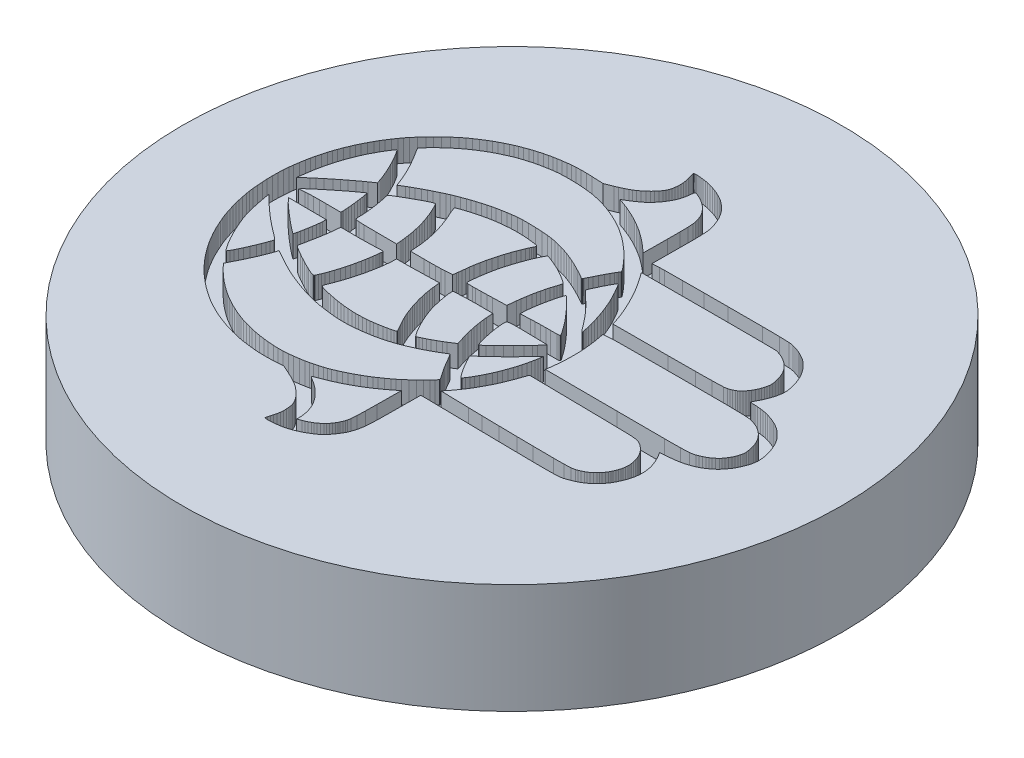
from build123d import *

# Parameters (mm, degrees)
CUT_EXTRUDE1_DEPTH = 1


with BuildPart() as part:
    # Sketch1 → Revolve1 (revolve)
    with BuildSketch(Plane.XY):
        Polygon((0, 2.5), (0, 0.5), (12, 0.5), (12, -2.5), (15, -2.5), (15, 2.5), align=None)
    revolve(axis=Axis((0, 0, 0), (0, 1, 0)))

    # Sketch3 → Cut-Extrude1 (cut)
    with BuildSketch(Plane(origin=(0, 2.5, 0), x_dir=(1, 0, 0), z_dir=(0, 1, 0))):
        with BuildLine():
            Line((-10.927264373, -0.656927744), (-10.905797986, -0.88953156))
            ThreePointArc((-10.905797986, -0.88953156), (-10.895828823, -0.977832974), (-10.883963175, -1.065899599))
            ThreePointArc((-10.883963175, -1.065899599), (-10.870786628, -1.150702383), (-10.856006762, -1.235240475))
            Line((-10.856006762, -1.235240475), (-10.815347299, -1.443691684))
            Line((-10.815347299, -1.443691684), (-10.769509114, -1.655882092))
            ThreePointArc((-10.769509114, -1.655882092), (-10.748099666, -1.74708561), (-10.725273768, -1.837944977))
            ThreePointArc((-10.725273768, -1.837944977), (-10.701270917, -1.927815304), (-10.675997078, -2.017336507))
            Line((-10.675997078, -2.017336507), (-10.614771766, -2.221219918))
            Line((-10.614771766, -2.221219918), (-10.551666801, -2.417710246))
            ThreePointArc((-10.551666801, -2.417710246), (-10.525078464, -2.495419228), (-10.497039736, -2.572616736))
            ThreePointArc((-10.497039736, -2.572616736), (-10.467104564, -2.65040205), (-10.435678944, -2.727597258))
            Line((-10.435678944, -2.727597258), (-10.350971546, -2.925001646))
            Line((-10.350971546, -2.925001646), (-10.258594396, -3.129930078))
            ThreePointArc((-10.258594396, -3.129930078), (-10.216044493, -3.220566016), (-10.172341406, -3.310651575))
            ThreePointArc((-10.172341406, -3.310651575), (-10.125907785, -3.402544043), (-10.07767798, -3.493506632))
            ThreePointArc((-10.07767798, -3.493506632), (-10.019116206, -3.599849919), (-9.959278984, -3.705480799))
            ThreePointArc((-9.959278984, -3.705480799), (-9.898742126, -3.809406791), (-9.836956161, -3.912595054))
            ThreePointArc((-9.836956161, -3.912595054), (-9.784584827, -3.996833822), (-9.73042647, -4.07993496))
            ThreePointArc((-9.73042647, -4.07993496), (-9.675880539, -4.160321621), (-9.620067888, -4.239834022))
            Line((-9.620067888, -4.239834022), (-9.486257921, -4.423397455))
            Line((-9.486257921, -4.423397455), (-9.350927078, -4.601478163))
            ThreePointArc((-9.350927078, -4.601478163), (-9.29429652, -4.673117538), (-9.236371611, -4.743714459))
            ThreePointArc((-9.236371611, -4.743714459), (-9.178306688, -4.811956802), (-9.119052743, -4.87916932))
            Line((-9.119052743, -4.87916932), (-8.975546977, -5.035728533))
            Line((-8.975546977, -5.035728533), (-8.829633809, -5.188289653))
            ThreePointArc((-8.829633809, -5.188289653), (-8.76792559, -5.250294188), (-8.705079485, -5.3111451))
            ThreePointArc((-8.705079485, -5.3111451), (-8.640018219, -5.371783259), (-8.573783073, -5.431136945))
            Line((-8.573783073, -5.431136945), (-8.40637854, -5.575188095))
            Line((-8.40637854, -5.575188095), (-8.231901911, -5.719182745))
            ThreePointArc((-8.231901911, -5.719182745), (-8.155263828, -5.780128036), (-8.077673988, -5.839856932))
            ThreePointArc((-8.077673988, -5.839856932), (-7.999066782, -5.898329799), (-7.91946463, -5.955440799))
            ThreePointArc((-7.91946463, -5.955440799), (-7.826485411, -6.020170821), (-7.732789234, -6.083858634))
            ThreePointArc((-7.732789234, -6.083858634), (-7.640550793, -6.145057182), (-7.54763117, -6.205216437))
            ThreePointArc((-7.54763117, -6.205216437), (-7.471901636, -6.252522191), (-7.395186714, -6.298212644))
            ThreePointArc((-7.395186714, -6.298212644), (-7.320264117, -6.340961057), (-7.244660947, -6.382493975))
            Line((-7.244660947, -6.382493975), (-7.066381764, -6.476236687))
            Line((-7.066381764, -6.476236687), (-6.88916483, -6.564853112))
            ThreePointArc((-6.88916483, -6.564853112), (-6.816224741, -6.59955836), (-6.742648073, -6.632892797))
            ThreePointArc((-6.742648073, -6.632892797), (-6.668990133, -6.664723923), (-6.59482439, -6.695353243))
            Line((-6.59482439, -6.695353243), (-6.413735637, -6.766495638))
            Line((-6.413735637, -6.766495638), (-6.229730089, -6.834912792))
            ThreePointArc((-6.229730089, -6.834912792), (-6.151307859, -6.862593004), (-6.072479112, -6.889093361))
            ThreePointArc((-6.072479112, -6.889093361), (-5.992628008, -6.914515303), (-5.91235221, -6.938562555))
            Line((-5.91235221, -6.938562555), (-5.719277297, -6.992491593))
            Line((-5.719277297, -6.992491593), (-5.525122753, -7.042523093))
            ThreePointArc((-5.525122753, -7.042523093), (-5.443544575, -7.061929154), (-5.361645712, -7.07993389))
            ThreePointArc((-5.361645712, -7.07993389), (-5.275788165, -7.096966696), (-5.189547122, -7.111937245))
            ThreePointArc((-5.189547122, -7.111937245), (-5.078150899, -7.129252608), (-4.966564783, -7.145298755))
            ThreePointArc((-4.966564783, -7.145298755), (-4.849619521, -7.160765432), (-4.732507297, -7.174912494))
            ThreePointArc((-4.732507297, -7.174912494), (-4.627998295, -7.186097922), (-4.523324513, -7.195618673))
            ThreePointArc((-4.523324513, -7.195618673), (-4.409353085, -7.204002601), (-4.295245216, -7.210261287))
            ThreePointArc((-4.295245216, -7.210261287), (-4.179129921, -7.214514413), (-4.062957468, -7.216708075))
            ThreePointArc((-4.062957468, -7.216708075), (-3.95063266, -7.216808797), (-3.83832469, -7.214861317))
            ThreePointArc((-3.83832469, -7.214861317), (-3.735817272, -7.210921445), (-3.633433416, -7.204530869))
            Line((-3.633433416, -7.204530869), (-3.221077057, -7.173837815))
            Line((-3.221077057, -7.173837815), (-2.840127748, -7.343770444))
            ThreePointArc((-2.840127748, -7.343770444), (-2.758677064, -7.380962237), (-2.677890275, -7.419574905))
            ThreePointArc((-2.677890275, -7.419574905), (-2.591330234, -7.462631163), (-2.505377982, -7.506888278))
            ThreePointArc((-2.505377982, -7.506888278), (-2.426244656, -7.549046826), (-2.347713169, -7.592316122))
            ThreePointArc((-2.347713169, -7.592316122), (-2.291012897, -7.625395333), (-2.23550406, -7.660437082))
            ThreePointArc((-2.23550406, -7.660437082), (-2.185229703, -7.694710731), (-2.136204642, -7.730748731))
            ThreePointArc((-2.136204642, -7.730748731), (-2.078721581, -7.775551594), (-2.022182568, -7.821540058))
            ThreePointArc((-2.022182568, -7.821540058), (-1.966460426, -7.868821728), (-1.91173272, -7.917250973))
            ThreePointArc((-1.91173272, -7.917250973), (-1.86682336, -7.959269518), (-1.823398285, -8.002820313))
            ThreePointArc((-1.823398285, -8.002820313), (-1.783361679, -8.046019097), (-1.745011908, -8.090722114))
            ThreePointArc((-1.745011908, -8.090722114), (-1.704418298, -8.141383787), (-1.665294576, -8.193189004))
            ThreePointArc((-1.665294576, -8.193189004), (-1.629759643, -8.243182143), (-1.59569455, -8.294188172))
            ThreePointArc((-1.59569455, -8.294188172), (-1.571433486, -8.334435357), (-1.549779492, -8.376143147))
            ThreePointArc((-1.549779492, -8.376143147), (-1.529106805, -8.422864604), (-1.511321147, -8.470759542))
            ThreePointArc((-1.511321147, -8.470759542), (-1.495592525, -8.521882437), (-1.482603441, -8.57376908))
            ThreePointArc((-1.482603441, -8.57376908), (-1.471510377, -8.630192915), (-1.463203172, -8.687093667))
            ThreePointArc((-1.463203172, -8.687093667), (-1.456800654, -8.749816093), (-1.452743335, -8.812733762))
            ThreePointArc((-1.452743335, -8.812733762), (-1.45096231, -8.880364688), (-1.451806801, -8.94801379))
            ThreePointArc((-1.451806801, -8.94801379), (-1.455316912, -9.011600141), (-1.46178017, -9.074954471))
            ThreePointArc((-1.46178017, -9.074954471), (-1.471384437, -9.13961819), (-1.483890329, -9.203783921))
            ThreePointArc((-1.483890329, -9.203783921), (-1.500578396, -9.274626809), (-1.519572362, -9.344886582))
            Line((-1.519572362, -9.344886582), (-1.54973208, -9.451788619))
            Line((-1.54973208, -9.451788619), (-1.575200495, -9.546820708))
            Line((-1.575200495, -9.546820708), (-1.5957606, -9.627372491))
            ThreePointArc((-1.5957606, -9.627372491), (-1.597745331, -9.637920296), (-1.598458917, -9.648629458))
            ThreePointArc((-1.598458917, -9.648629458), (-1.595399977, -9.656488938), (-1.587782911, -9.660109552))
            Line((-1.587782911, -9.660109552), (-1.50456627, -9.664148382))
            ThreePointArc((-1.50456627, -9.664148382), (-1.452919995, -9.664990925), (-1.40127155, -9.664293963))
            ThreePointArc((-1.40127155, -9.664293963), (-1.339877329, -9.662003102), (-1.278533622, -9.658619627))
            ThreePointArc((-1.278533622, -9.658619627), (-1.209141447, -9.653392089), (-1.139883612, -9.646613195))
            ThreePointArc((-1.139883612, -9.646613195), (-1.063796453, -9.637658703), (-0.987870312, -9.627428364))
            ThreePointArc((-0.987870312, -9.627428364), (-0.916513561, -9.616583722), (-0.845351321, -9.604528525))
            ThreePointArc((-0.845351321, -9.604528525), (-0.791747179, -9.593912939), (-0.738590109, -9.581247218))
            ThreePointArc((-0.738590109, -9.581247218), (-0.685833723, -9.566514512), (-0.633682182, -9.54976621))
            ThreePointArc((-0.633682182, -9.54976621), (-0.565154041, -9.525652315), (-0.497040704, -9.500390496))
            ThreePointArc((-0.497040704, -9.500390496), (-0.425051283, -9.472314858), (-0.353537745, -9.443048289))
            ThreePointArc((-0.353537745, -9.443048289), (-0.288937196, -9.415145115), (-0.224964844, -9.385830339))
            ThreePointArc((-0.224964844, -9.385830339), (-0.161189989, -9.354649108), (-0.098318633, -9.321684066))
            ThreePointArc((-0.098318633, -9.321684066), (-0.029058361, -9.283201905), (0.039407093, -9.243322792))
            ThreePointArc((0.039407093, -9.243322792), (0.103842493, -9.204009223), (0.167457942, -9.163382237))
            ThreePointArc((0.167457942, -9.163382237), (0.21568725, -9.130361528), (0.262434595, -9.095274223))
            ThreePointArc((0.262434595, -9.095274223), (0.306299534, -9.059094024), (0.348373428, -9.020845793))
            ThreePointArc((0.348373428, -9.020845793), (0.398446693, -8.971820131), (0.447232004, -8.921512669))
            ThreePointArc((0.447232004, -8.921512669), (0.495777499, -8.868791735), (0.542948376, -8.814837399))
            ThreePointArc((0.542948376, -8.814837399), (0.582282539, -8.76676893), (0.619689155, -8.717185675))
            ThreePointArc((0.619689155, -8.717185675), (0.654336012, -8.668091995), (0.687792118, -8.61817924))
            ThreePointArc((0.687792118, -8.61817924), (0.722957702, -8.563205908), (0.757084333, -8.507581645))
            ThreePointArc((0.757084333, -8.507581645), (0.787912611, -8.45513381), (0.817736997, -8.402108683))
            ThreePointArc((0.817736997, -8.402108683), (0.838582328, -8.362075228), (0.85758363, -8.321134346))
            ThreePointArc((0.85758363, -8.321134346), (0.874770117, -8.279372862), (0.890158539, -8.236915904))
            ThreePointArc((0.890158539, -8.236915904), (0.909170609, -8.179054576), (0.92714877, -8.120863702))
            ThreePointArc((0.92714877, -8.120863702), (0.945324997, -8.05811272), (0.962394707, -7.99505175))
            ThreePointArc((0.962394707, -7.99505175), (0.97694143, -7.936694992), (0.990169616, -7.878025294))
            ThreePointArc((0.990169616, -7.878025294), (1.007785616, -7.781650633), (1.019648624, -7.684400092))
            ThreePointArc((1.019648624, -7.684400092), (1.030470896, -7.549530333), (1.038159267, -7.414445685))
            ThreePointArc((1.038159267, -7.414445685), (1.045517869, -7.219384988), (1.049934288, -7.024235508))
            Line((1.049934288, -7.024235508), (1.056662391, -6.409471655))
            Line((1.056662391, -6.409471655), (1.064793966, -5.214069953))
            Line((1.064793966, -5.214069953), (4.200409452, -5.260874939))
            Line((4.200409452, -5.260874939), (6.012042888, -5.28615873))
            ThreePointArc((6.012042888, -5.28615873), (6.429099542, -5.289950253), (6.846173076, -5.290493674))
            ThreePointArc((6.846173076, -5.290493674), (7.091047776, -5.288243863), (7.335871479, -5.282763512))
            ThreePointArc((7.335871479, -5.282763512), (7.446684437, -5.273482113), (7.5558264, -5.252182157))
            ThreePointArc((7.5558264, -5.252182157), (7.607820069, -5.237920172), (7.659188932, -5.221549901))
            ThreePointArc((7.659188932, -5.221549901), (7.725002707, -5.198383482), (7.790361698, -5.173963444))
            ThreePointArc((7.790361698, -5.173963444), (7.858526184, -5.147007809), (7.926168967, -5.118768524))
            ThreePointArc((7.926168967, -5.118768524), (7.986237554, -5.092085755), (8.045586955, -5.063839447))
            ThreePointArc((8.045586955, -5.063839447), (8.108686374, -5.03105293), (8.170289297, -4.995534309))
            ThreePointArc((8.170289297, -4.995534309), (8.235797237, -4.954289341), (8.29986601, -4.910842476))
            ThreePointArc((8.29986601, -4.910842476), (8.362216916, -4.865389249), (8.422983789, -4.817839081))
            ThreePointArc((8.422983789, -4.817839081), (8.476628916, -4.772335698), (8.528176965, -4.724469676))
            ThreePointArc((8.528176965, -4.724469676), (8.574651876, -4.677432703), (8.619152508, -4.628523726))
            ThreePointArc((8.619152508, -4.628523726), (8.66878679, -4.570121281), (8.716855657, -4.510423781))
            ThreePointArc((8.716855657, -4.510423781), (8.762448162, -4.450614418), (8.806430842, -4.389611466))
            ThreePointArc((8.806430842, -4.389611466), (8.840427285, -4.33851023), (8.871899335, -4.285816735))
            ThreePointArc((8.871899335, -4.285816735), (8.900902143, -4.232573941), (8.928262203, -4.178468625))
            ThreePointArc((8.928262203, -4.178468625), (8.959428904, -4.112932667), (8.98941444, -4.046847928))
            ThreePointArc((8.98941444, -4.046847928), (9.018258315, -3.980123344), (9.045900605, -3.91289208))
            ThreePointArc((9.045900605, -3.91289208), (9.067746872, -3.855898449), (9.087865245, -3.798272201))
            ThreePointArc((9.087865245, -3.798272201), (9.107743721, -3.734303772), (9.125109385, -3.669607964))
            ThreePointArc((9.125109385, -3.669607964), (9.139979469, -3.604131723), (9.152299765, -3.538128179))
            ThreePointArc((9.152299765, -3.538128179), (9.162105093, -3.471377735), (9.16932778, -3.404298684))
            ThreePointArc((9.16932778, -3.404298684), (9.174017697, -3.336512813), (9.176144096, -3.268598175))
            ThreePointArc((9.176144096, -3.268598175), (9.175720649, -3.200302696), (9.172756145, -3.132070273))
            ThreePointArc((9.172756145, -3.132070273), (9.167285389, -3.065271952), (9.159188843, -2.998740825))
            ThreePointArc((9.159188843, -2.998740825), (9.148531907, -2.932956592), (9.135277723, -2.867646087))
            ThreePointArc((9.135277723, -2.867646087), (9.119353039, -2.802396494), (9.100915674, -2.737811911))
            ThreePointArc((9.100915674, -2.737811911), (9.08223501, -2.68051719), (9.061533245, -2.62392135))
            ThreePointArc((9.061533245, -2.62392135), (9.035370599, -2.558318381), (9.007762482, -2.493310492))
            ThreePointArc((9.007762482, -2.493310492), (8.979067018, -2.429699339), (8.948966378, -2.366740941))
            ThreePointArc((8.948966378, -2.366740941), (8.922589744, -2.315679727), (8.894218646, -2.265699178))
            Line((8.894218646, -2.265699178), (8.845129816, -2.182446169))
            Line((8.845129816, -2.182446169), (8.803790221, -2.110959692))
            Line((8.803790221, -2.110959692), (8.767831372, -2.047869594))
            ThreePointArc((8.767831372, -2.047869594), (8.766612746, -2.044871352), (8.766211952, -2.041659831))
            ThreePointArc((8.766211952, -2.041659831), (8.767190726, -2.039174721), (8.769585545, -2.03799209))
            Line((8.769585545, -2.03799209), (8.867150619, -2.029284378))
            Line((8.867150619, -2.029284378), (8.978041923, -2.020371762))
            Line((8.978041923, -2.020371762), (9.109751884, -2.011405664))
            ThreePointArc((9.109751884, -2.011405664), (9.18581858, -2.005637021), (9.261720085, -1.997996282))
            ThreePointArc((9.261720085, -1.997996282), (9.348346875, -1.987472013), (9.43478826, -1.975520105))
            ThreePointArc((9.43478826, -1.975520105), (9.51843099, -1.962540336), (9.601846489, -1.94817248))
            ThreePointArc((9.601846489, -1.94817248), (9.668113241, -1.93508026), (9.733921814, -1.919851325))
            ThreePointArc((9.733921814, -1.919851325), (9.797354096, -1.902841444), (9.860117379, -1.883508555))
            ThreePointArc((9.860117379, -1.883508555), (9.9343789, -1.858232065), (10.008074019, -1.831348914))
            ThreePointArc((10.008074019, -1.831348914), (10.081243265, -1.802842715), (10.153776413, -1.772754771))
            ThreePointArc((10.153776413, -1.772754771), (10.213924824, -1.745727226), (10.27304759, -1.716524175))
            ThreePointArc((10.27304759, -1.716524175), (10.33152951, -1.684533281), (10.388441911, -1.649826928))
            ThreePointArc((10.388441911, -1.649826928), (10.453756431, -1.606503387), (10.517784029, -1.5612996))
            ThreePointArc((10.517784029, -1.5612996), (10.580699192, -1.514083972), (10.642217273, -1.465061946))
            ThreePointArc((10.642217273, -1.465061946), (10.693459519, -1.421003699), (10.742639023, -1.374654229))
            ThreePointArc((10.742639023, -1.374654229), (10.78940265, -1.326370563), (10.833917294, -1.276005936))
            ThreePointArc((10.833917294, -1.276005936), (10.883727225, -1.215246515), (10.931775695, -1.153084784))
            ThreePointArc((10.931775695, -1.153084784), (10.977765299, -1.089923009), (11.021922695, -1.025466994))
            ThreePointArc((11.021922695, -1.025466994), (11.057007481, -0.969799287), (11.089390749, -0.912517879))
            ThreePointArc((11.089390749, -0.912517879), (11.118064551, -0.857112599), (11.145281521, -0.800977329))
            ThreePointArc((11.145281521, -0.800977329), (11.173798169, -0.738562464), (11.201083357, -0.675599514))
            ThreePointArc((11.201083357, -0.675599514), (11.225603047, -0.615805149), (11.248928453, -0.555534869))
            ThreePointArc((11.248928453, -0.555534869), (11.26511183, -0.50932619), (11.279205552, -0.462437912))
            ThreePointArc((11.279205552, -0.462437912), (11.290332031, -0.419677737), (11.30017228, -0.376603376))
            ThreePointArc((11.30017228, -0.376603376), (11.309775878, -0.328840689), (11.318308468, -0.280875094))
            ThreePointArc((11.318308468, -0.280875094), (11.32534133, -0.235426912), (11.331342298, -0.189831005))
            ThreePointArc((11.331342298, -0.189831005), (11.334644648, -0.154941336), (11.336188422, -0.119929748))
            ThreePointArc((11.336188422, -0.119929748), (11.335931499, -0.083097235), (11.333768422, -0.046327396))
            ThreePointArc((11.333768422, -0.046327396), (11.328824754, 0.006221395), (11.32292077, 0.058670973))
            ThreePointArc((11.32292077, 0.058670973), (11.315367766, 0.116314315), (11.30677274, 0.173811517))
            ThreePointArc((11.30677274, 0.173811517), (11.297526553, 0.228349472), (11.28713669, 0.282681151))
            ThreePointArc((11.28713669, 0.282681151), (11.273544971, 0.342651829), (11.257159956, 0.401920271))
            ThreePointArc((11.257159956, 0.401920271), (11.233730544, 0.476413049), (11.208582098, 0.550343199))
            ThreePointArc((11.208582098, 0.550343199), (11.180648187, 0.626647298), (11.150971893, 0.70229078))
            ThreePointArc((11.150971893, 0.70229078), (11.122809444, 0.768573367), (11.09248317, 0.833894282))
            ThreePointArc((11.09248317, 0.833894282), (11.053778776, 0.910204245), (11.012308736, 0.985047256))
            ThreePointArc((11.012308736, 0.985047256), (10.972183987, 1.050563856), (10.92880465, 1.113972479))
            ThreePointArc((10.92880465, 1.113972479), (10.882245114, 1.175162566), (10.832660655, 1.23392819))
            ThreePointArc((10.832660655, 1.23392819), (10.774566907, 1.297007881), (10.714216169, 1.357931763))
            ThreePointArc((10.714216169, 1.357931763), (10.652952797, 1.415349066), (10.589560935, 1.470407392))
            ThreePointArc((10.589560935, 1.470407392), (10.527142941, 1.520295668), (10.46259574, 1.567396678))
            ThreePointArc((10.46259574, 1.567396678), (10.395590584, 1.611937655), (10.326709932, 1.653519448))
            ThreePointArc((10.326709932, 1.653519448), (10.251702838, 1.694815556), (10.175252448, 1.733374222))
            ThreePointArc((10.175252448, 1.733374222), (10.107402017, 1.764672721), (10.038535065, 1.793666165))
            ThreePointArc((10.038535065, 1.793666165), (9.958704288, 1.824666335), (9.878197643, 1.853866397))
            ThreePointArc((9.878197643, 1.853866397), (9.799300252, 1.880487038), (9.719821011, 1.905316598))
            ThreePointArc((9.719821011, 1.905316598), (9.655384629, 1.923139982), (9.590237684, 1.938159831))
            ThreePointArc((9.590237684, 1.938159831), (9.527677018, 1.950281839), (9.464810457, 1.9607018))
            ThreePointArc((9.464810457, 1.9607018), (9.392627041, 1.970992091), (9.32026867, 1.979969942))
            ThreePointArc((9.32026867, 1.979969942), (9.249905338, 1.987400688), (9.179417852, 1.993543071))
            ThreePointArc((9.179417852, 1.993543071), (9.122985018, 1.996934965), (9.066467373, 1.998322552))
            ThreePointArc((9.066467373, 1.998322552), (9.020469303, 1.999125198), (8.97449875, 2.000907033))
            ThreePointArc((8.97449875, 2.000907033), (8.93687618, 2.003491023), (8.899380422, 2.007516309))
            ThreePointArc((8.899380422, 2.007516309), (8.871243568, 2.011537538), (8.843248141, 2.016447622))
            ThreePointArc((8.843248141, 2.016447622), (8.837870275, 2.0205447), (8.83789327, 2.027305393))
            Line((8.83789327, 2.027305393), (8.847707769, 2.046800819))
            Line((8.847707769, 2.046800819), (8.887630733, 2.125815347))
            Line((8.887630733, 2.125815347), (8.934718761, 2.218980595))
            Line((8.934718761, 2.218980595), (8.987955615, 2.324273619))
            ThreePointArc((8.987955615, 2.324273619), (9.017433488, 2.385241547), (9.044719323, 2.447221514))
            ThreePointArc((9.044719323, 2.447221514), (9.074464974, 2.520493076), (9.102556617, 2.594414554))
            ThreePointArc((9.102556617, 2.594414554), (9.128596133, 2.667875652), (9.152971804, 2.741905484))
            ThreePointArc((9.152971804, 2.741905484), (9.17104523, 2.803246075), (9.186617463, 2.865268832))
            ThreePointArc((9.186617463, 2.865268832), (9.200371293, 2.929652842), (9.212154047, 2.994426567))
            ThreePointArc((9.212154047, 2.994426567), (9.220891438, 3.054263329), (9.22726756, 3.114397556))
            ThreePointArc((9.22726756, 3.114397556), (9.230780296, 3.168967418), (9.231924257, 3.223638257))
            ThreePointArc((9.231924257, 3.223638257), (9.230381218, 3.27207946), (9.225831994, 3.320331255))
            ThreePointArc((9.225831994, 3.320331255), (9.219265776, 3.365510284), (9.210966302, 3.410403251))
            ThreePointArc((9.210966302, 3.410403251), (9.197874755, 3.471943283), (9.183854026, 3.533278291))
            ThreePointArc((9.183854026, 3.533278291), (9.167675735, 3.599456778), (9.150510334, 3.665386121))
            ThreePointArc((9.150510334, 3.665386121), (9.133501524, 3.726503762), (9.115365045, 3.787296309))
            ThreePointArc((9.115365045, 3.787296309), (9.09473648, 3.849871062), (9.071712741, 3.911604722))
            ThreePointArc((9.071712741, 3.911604722), (9.04294884, 3.981800835), (9.012417355, 4.051246387))
            ThreePointArc((9.012417355, 4.051246387), (8.980901708, 4.11825799), (8.947688846, 4.184444823))
            ThreePointArc((8.947688846, 4.184444823), (8.918876985, 4.236975425), (8.887593905, 4.288072943))
            ThreePointArc((8.887593905, 4.288072943), (8.856760627, 4.334643049), (8.824853166, 4.380483857))
            ThreePointArc((8.824853166, 4.380483857), (8.789047233, 4.429730077), (8.752362878, 4.47832548))
            ThreePointArc((8.752362878, 4.47832548), (8.717249611, 4.523132449), (8.681327358, 4.567293492))
            ThreePointArc((8.681327358, 4.567293492), (8.653535352, 4.599406403), (8.624393566, 4.630299622))
            Line((8.624393566, 4.630299622), (8.569415794, 4.684220765))
            Line((8.569415794, 4.684220765), (8.505607873, 4.743198165))
            Line((8.505607873, 4.743198165), (8.443012537, 4.798279868))
            ThreePointArc((8.443012537, 4.798279868), (8.417995772, 4.819211009), (8.392457661, 4.839502783))
            ThreePointArc((8.392457661, 4.839502783), (8.364326246, 4.860260656), (8.335267422, 4.879699035))
            ThreePointArc((8.335267422, 4.879699035), (8.292349641, 4.906521276), (8.249012093, 4.932659856))
            ThreePointArc((8.249012093, 4.932659856), (8.20066986, 4.960785855), (8.151891595, 4.988148681))
            ThreePointArc((8.151891595, 4.988148681), (8.104864951, 5.013495595), (8.057388934, 5.037990473))
            ThreePointArc((8.057388934, 5.037990473), (8.005764051, 5.062878027), (7.9532729, 5.08588233))
            ThreePointArc((7.9532729, 5.08588233), (7.890098744, 5.111418996), (7.826387022, 5.135583265))
            ThreePointArc((7.826387022, 5.135583265), (7.762303932, 5.158314958), (7.697743904, 5.179654475))
            ThreePointArc((7.697743904, 5.179654475), (7.643285398, 5.195904454), (7.588265018, 5.210136408))
            ThreePointArc((7.588265018, 5.210136408), (7.474515098, 5.231790509), (7.359244195, 5.242770636))
            ThreePointArc((7.359244195, 5.242770636), (7.132972648, 5.252042036), (6.906588139, 5.257943412))
            ThreePointArc((6.906588139, 5.257943412), (6.526039197, 5.263417947), (6.145457555, 5.265672139))
            Line((6.145457555, 5.265672139), (4.560566908, 5.266507273))
            Line((4.560566908, 5.266507273), (3.470526756, 5.264611357))
            Line((3.470526756, 5.264611357), (2.499978464, 5.260341406))
            Line((2.499978464, 5.260341406), (1.680353289, 5.254734736))
            ThreePointArc((1.680353289, 5.254734736), (1.56811639, 5.252619979), (1.455954245, 5.248010578))
            Line((1.455954245, 5.248010578), (1.135847245, 5.231288799))
            Line((1.135847245, 5.231288799), (1.143492239, 6.448525372))
            Line((1.143492239, 6.448525372), (1.144780563, 7.059101716))
            ThreePointArc((1.144780563, 7.059101716), (1.142971352, 7.259291162), (1.138369009, 7.459435874))
            ThreePointArc((1.138369009, 7.459435874), (1.132783345, 7.598609094), (1.124375018, 7.73764033))
            ThreePointArc((1.124375018, 7.73764033), (1.114820308, 7.830278343), (1.099318893, 7.92210862))
            ThreePointArc((1.099318893, 7.92210862), (1.085729099, 7.982073256), (1.069347475, 8.041336081))
            ThreePointArc((1.069347475, 8.041336081), (1.045927936, 8.115808567), (1.020789683, 8.189718607))
            ThreePointArc((1.020789683, 8.189718607), (0.992869436, 8.265993838), (0.963207314, 8.341608715))
            ThreePointArc((0.963207314, 8.341608715), (0.935061414, 8.407857319), (0.904751752, 8.473144329))
            ThreePointArc((0.904751752, 8.473144329), (0.87151381, 8.538532269), (0.83579193, 8.602597008))
            ThreePointArc((0.83579193, 8.602597008), (0.794540373, 8.670994819), (0.751273488, 8.738135925))
            ThreePointArc((0.751273488, 8.738135925), (0.707911623, 8.801182092), (0.662657208, 8.862883862))
            ThreePointArc((0.662657208, 8.862883862), (0.623473452, 8.91179928), (0.581669933, 8.958495647))
            ThreePointArc((0.581669933, 8.958495647), (0.539876588, 9.001079934), (0.496539549, 9.042092204))
            ThreePointArc((0.496539549, 9.042092204), (0.44324375, 9.089649017), (0.38893114, 9.136041184))
            ThreePointArc((0.38893114, 9.136041184), (0.333487932, 9.181361285), (0.277077444, 9.225471578))
            ThreePointArc((0.277077444, 9.225471578), (0.228553484, 9.261206583), (0.178770909, 9.29516627))
            ThreePointArc((0.178770909, 9.29516627), (0.126077295, 9.328208722), (0.072073039, 9.359062588))
            ThreePointArc((0.072073039, 9.359062588), (0.003108156, 9.395677633), (-0.066608947, 9.430839292))
            ThreePointArc((-0.066608947, 9.430839292), (-0.139369116, 9.465650137), (-0.212837201, 9.49894094))
            ThreePointArc((-0.212837201, 9.49894094), (-0.278023696, 9.526478546), (-0.344025196, 9.552001104))
            ThreePointArc((-0.344025196, 9.552001104), (-0.410775515, 9.57565305), (-0.478122283, 9.597548995))
            ThreePointArc((-0.478122283, 9.597548995), (-0.555478255, 9.620836004), (-0.633233864, 9.642751672))
            ThreePointArc((-0.633233864, 9.642751672), (-0.708878518, 9.662630275), (-0.784865371, 9.681157841))
            ThreePointArc((-0.784865371, 9.681157841), (-0.845704642, 9.69430128), (-0.90696621, 9.705309786))
            Line((-0.90696621, 9.705309786), (-1.018428784, 9.721648093))
            Line((-1.018428784, 9.721648093), (-1.136102129, 9.735608592))
            Line((-1.136102129, 9.735608592), (-1.243255797, 9.745558196))
            ThreePointArc((-1.243255797, 9.745558196), (-1.280643451, 9.747862034), (-1.318090267, 9.748800292))
            ThreePointArc((-1.318090267, 9.748800292), (-1.34655473, 9.748541471), (-1.37499658, 9.747377953))
            ThreePointArc((-1.37499658, 9.747377953), (-1.399044915, 9.745382984), (-1.422957193, 9.742141806))
            ThreePointArc((-1.422957193, 9.742141806), (-1.441105013, 9.738752983), (-1.459070082, 9.734500485))
            ThreePointArc((-1.459070082, 9.734500485), (-1.464530968, 9.730897381), (-1.466674098, 9.724715907))
            ThreePointArc((-1.466674098, 9.724715907), (-1.466179886, 9.715668713), (-1.464581729, 9.706750089))
            Line((-1.464581729, 9.706750089), (-1.444776842, 9.626423098))
            Line((-1.444776842, 9.626423098), (-1.420599144, 9.53225959))
            Line((-1.420599144, 9.53225959), (-1.391890181, 9.425340661))
            ThreePointArc((-1.391890181, 9.425340661), (-1.373853795, 9.354828995), (-1.358131028, 9.283765636))
            ThreePointArc((-1.358131028, 9.283765636), (-1.346499212, 9.21943571), (-1.337775528, 9.154647318))
            ThreePointArc((-1.337775528, 9.154647318), (-1.332174747, 9.091210924), (-1.329529998, 9.027582705))
            ThreePointArc((-1.329529998, 9.027582705), (-1.329605893, 8.959928375), (-1.332306812, 8.892327936))
            ThreePointArc((-1.332306812, 8.892327936), (-1.337256437, 8.82913816), (-1.34458194, 8.766179573))
            ThreePointArc((-1.34458194, 8.766179573), (-1.353772325, 8.708976073), (-1.365768949, 8.652294642))
            ThreePointArc((-1.365768949, 8.652294642), (-1.379708685, 8.599824788), (-1.396404607, 8.548165831))
            ThreePointArc((-1.396404607, 8.548165831), (-1.415313672, 8.499164435), (-1.43705263, 8.451351182))
            ThreePointArc((-1.43705263, 8.451351182), (-1.460463538, 8.407772412), (-1.487034021, 8.366044853))
            ThreePointArc((-1.487034021, 8.366044853), (-1.52601971, 8.311343443), (-1.566646398, 8.257849514))
            ThreePointArc((-1.566646398, 8.257849514), (-1.61225524, 8.201403131), (-1.659526445, 8.146341404))
            ThreePointArc((-1.659526445, 8.146341404), (-1.705218256, 8.096580603), (-1.752716727, 8.048541306))
            ThreePointArc((-1.752716727, 8.048541306), (-1.803512877, 8.000571921), (-1.855799682, 7.954231864))
            ThreePointArc((-1.855799682, 7.954231864), (-1.916773678, 7.903012688), (-1.978829478, 7.853109684))
            ThreePointArc((-1.978829478, 7.853109684), (-2.039931214, 7.806099091), (-2.102032729, 7.760417368))
            ThreePointArc((-2.102032729, 7.760417368), (-2.152652929, 7.725611454), (-2.204695515, 7.692970596))
            ThreePointArc((-2.204695515, 7.692970596), (-2.259768549, 7.661241251), (-2.315852887, 7.631335777))
            ThreePointArc((-2.315852887, 7.631335777), (-2.391339115, 7.59333812), (-2.467359044, 7.556419792))
            ThreePointArc((-2.467359044, 7.556419792), (-2.548828171, 7.518271413), (-2.630826325, 7.481273843))
            ThreePointArc((-2.630826325, 7.481273843), (-2.706089256, 7.448784323), (-2.781943173, 7.417699586))
            Line((-2.781943173, 7.417699586), (-3.133501152, 7.27743515))
            Line((-3.133501152, 7.27743515), (-3.670496426, 7.302668003))
            ThreePointArc((-3.670496426, 7.302668003), (-3.791387324, 7.307351268), (-3.912338948, 7.310043202))
            ThreePointArc((-3.912338948, 7.310043202), (-4.038097075, 7.310884314), (-4.163854017, 7.309881569))
            ThreePointArc((-4.163854017, 7.309881569), (-4.281369473, 7.307189648), (-4.398830448, 7.302712142))
            ThreePointArc((-4.398830448, 7.302712142), (-4.493643388, 7.29701895), (-4.588255204, 7.28862191))
            ThreePointArc((-4.588255204, 7.28862191), (-4.673969289, 7.279185817), (-4.759545978, 7.268575698))
            Line((-4.759545978, 7.268575698), (-4.960389606, 7.240543836))
            Line((-4.960389606, 7.240543836), (-5.158413756, 7.209474159))
            ThreePointArc((-5.158413756, 7.209474159), (-5.239521805, 7.195407493), (-5.320406499, 7.180108711))
            ThreePointArc((-5.320406499, 7.180108711), (-5.400431578, 7.163542021), (-5.480124001, 7.145442682))
            Line((-5.480124001, 7.145442682), (-5.670855635, 7.097953359))
            Line((-5.670855635, 7.097953359), (-5.861221329, 7.046043596))
            ThreePointArc((-5.861221329, 7.046043596), (-5.940828008, 7.022584869), (-6.019986119, 6.997654392))
            ThreePointArc((-6.019986119, 6.997654392), (-6.097489967, 6.971899718), (-6.174655681, 6.945148972))
            Line((-6.174655681, 6.945148972), (-6.352089143, 6.880680686))
            Line((-6.352089143, 6.880680686), (-6.524263499, 6.814831689))
            ThreePointArc((-6.524263499, 6.814831689), (-6.593156604, 6.787180868), (-6.661599886, 6.758434652))
            ThreePointArc((-6.661599886, 6.758434652), (-6.730859077, 6.727872702), (-6.79949541, 6.695936485))
            Line((-6.79949541, 6.695936485), (-6.97419132, 6.610467733))
            Line((-6.97419132, 6.610467733), (-7.154956065, 6.51773485))
            ThreePointArc((-7.154956065, 6.51773485), (-7.234617413, 6.475227346), (-7.313700378, 6.431653238))
            ThreePointArc((-7.313700378, 6.431653238), (-7.396424437, 6.384129052), (-7.478070147, 6.334775265))
            ThreePointArc((-7.478070147, 6.334775265), (-7.578143335, 6.27192934), (-7.677466592, 6.207904782))
            ThreePointArc((-7.677466592, 6.207904782), (-7.778295106, 6.141213857), (-7.878332527, 6.073342041))
            ThreePointArc((-7.878332527, 6.073342041), (-7.963906073, 6.013395034), (-8.048376962, 5.951904024))
            ThreePointArc((-8.048376962, 5.951904024), (-8.135913392, 5.885013454), (-8.221519101, 5.815669114))
            ThreePointArc((-8.221519101, 5.815669114), (-8.328258017, 5.72539334), (-8.433718637, 5.6336275))
            ThreePointArc((-8.433718637, 5.6336275), (-8.541853749, 5.536843682), (-8.648630629, 5.438563432))
            ThreePointArc((-8.648630629, 5.438563432), (-8.741308937, 5.350286411), (-8.832179917, 5.260150036))
            ThreePointArc((-8.832179917, 5.260150036), (-8.919395463, 5.170523745), (-9.005245423, 5.07958856))
            ThreePointArc((-9.005245423, 5.07958856), (-9.097265148, 4.97945374), (-9.188100156, 4.878243003))
            ThreePointArc((-9.188100156, 4.878243003), (-9.271685724, 4.782861827), (-9.354129799, 4.686492277))
            ThreePointArc((-9.354129799, 4.686492277), (-9.413697475, 4.61393368), (-9.471160699, 4.539697328))
            ThreePointArc((-9.471160699, 4.539697328), (-9.523477941, 4.468809243), (-9.574569264, 4.397032567))
            Line((-9.574569264, 4.397032567), (-9.69492762, 4.221193015))
            Line((-9.69492762, 4.221193015), (-9.812692248, 4.041715282))
            ThreePointArc((-9.812692248, 4.041715282), (-9.86111135, 3.964977317), (-9.908289706, 3.887470366))
            ThreePointArc((-9.908289706, 3.887470366), (-9.954798039, 3.808012788), (-9.999838371, 3.72771397))
            Line((-9.999838371, 3.72771397), (-10.105296053, 3.530775439))
            Line((-10.105296053, 3.530775439), (-10.207625652, 3.329788707))
            ThreePointArc((-10.207625652, 3.329788707), (-10.249410924, 3.24376106), (-10.289738547, 3.157040544))
            ThreePointArc((-10.289738547, 3.157040544), (-10.3283905, 3.07021897), (-10.3656488, 2.982790267))
            Line((-10.3656488, 2.982790267), (-10.448840554, 2.777333025))
            Line((-10.448840554, 2.777333025), (-10.526496008, 2.573776243))
            ThreePointArc((-10.526496008, 2.573776243), (-10.556490703, 2.490300154), (-10.584921809, 2.406278661))
            ThreePointArc((-10.584921809, 2.406278661), (-10.611814355, 2.321760057), (-10.637199858, 2.236776648))
            Line((-10.637199858, 2.236776648), (-10.695652422, 2.026961062))
            Line((-10.695652422, 2.026961062), (-10.750976536, 1.812418991))
            ThreePointArc((-10.750976536, 1.812418991), (-10.773097376, 1.720066462), (-10.793806607, 1.627387182))
            ThreePointArc((-10.793806607, 1.627387182), (-10.813417899, 1.532261969), (-10.831334135, 1.436802987))
            Line((-10.831334135, 1.436802987), (-10.87040991, 1.204431262))
            Line((-10.87040991, 1.204431262), (-10.905145845, 0.969119722))
            ThreePointArc((-10.905145845, 0.969119722), (-10.918055301, 0.869108016), (-10.929327749, 0.768898599))
            ThreePointArc((-10.929327749, 0.768898599), (-10.939263392, 0.66168352), (-10.946744749, 0.554269278))
            ThreePointArc((-10.946744749, 0.554269278), (-10.953046527, 0.430008712), (-10.957500452, 0.305668198))
            ThreePointArc((-10.957500452, 0.305668198), (-10.960196029, 0.177718984), (-10.961021311, 0.049744038))
            ThreePointArc((-10.961021311, 0.049744038), (-10.959833443, -0.069004048), (-10.956474764, -0.18771057))
            ThreePointArc((-10.956474764, -0.18771057), (-10.951579226, -0.299167243), (-10.945242354, -0.410551263))
            Line((-10.945242354, -0.410551263), (-10.927264373, -0.656927744))
        make_face()
        with BuildLine():
            Line((2.173202286, 1.317786658), (2.132371265, 1.480696734))
            ThreePointArc((2.132371265, 1.480696734), (2.108046725, 1.573041932), (2.081813667, 1.664863201))
            ThreePointArc((2.081813667, 1.664863201), (2.048358755, 1.775125886), (2.013597208, 1.884983638))
            ThreePointArc((2.013597208, 1.884983638), (1.977312532, 1.995096045), (1.93972518, 2.104770613))
            ThreePointArc((1.93972518, 2.104770613), (1.906544423, 2.19683727), (1.871564061, 2.288235334))
            Line((1.871564061, 2.288235334), (1.803548628, 2.457052122))
            Line((1.803548628, 2.457052122), (1.730332474, 2.631439284))
            Line((1.730332474, 2.631439284), (1.662358616, 2.787328622))
            ThreePointArc((1.662358616, 2.787328622), (1.638472676, 2.839600771), (1.613485818, 2.891355699))
            Line((1.613485818, 2.891355699), (1.564090379, 2.988178466))
            Line((1.564090379, 2.988178466), (1.495918538, 3.11661044))
            Line((1.495918538, 3.11661044), (1.421896741, 3.252868727))
            Line((1.421896741, 3.252868727), (1.352954877, 3.376479111))
            ThreePointArc((1.352954877, 3.376479111), (1.32133461, 3.431274923), (1.288808935, 3.485538195))
            ThreePointArc((1.288808935, 3.485538195), (1.259679037, 3.531892186), (1.229374676, 3.577487023))
            Line((1.229374676, 3.577487023), (1.177182876, 3.651576549))
            ThreePointArc((1.177182876, 3.651576549), (1.16894688, 3.658638001), (1.158411092, 3.661225066))
            ThreePointArc((1.158411092, 3.661225066), (1.147590609, 3.658400433), (1.13963755, 3.650538483))
            Line((1.13963755, 3.650538483), (1.070452352, 3.530226313))
            ThreePointArc((1.070452352, 3.530226313), (1.030745554, 3.458513746), (0.992342281, 3.386094753))
            Line((0.992342281, 3.386094753), (0.906011638, 3.21495143))
            Line((0.906011638, 3.21495143), (0.821205926, 3.039573636))
            Line((0.821205926, 3.039573636), (0.747597702, 2.882145561))
            Line((0.747597702, 2.882145561), (0.68724659, 2.748873527))
            ThreePointArc((0.68724659, 2.748873527), (0.679661189, 2.729272969), (0.674129113, 2.708996965))
            ThreePointArc((0.674129113, 2.708996965), (0.674155881, 2.688671223), (0.682698387, 2.67022774))
            ThreePointArc((0.682698387, 2.67022774), (0.714439901, 2.630132991), (0.747733503, 2.591317418))
            ThreePointArc((0.747733503, 2.591317418), (0.795082385, 2.540355054), (0.844433826, 2.491329403))
            ThreePointArc((0.844433826, 2.491329403), (0.910915091, 2.4290235), (0.978515678, 2.367933853))
            ThreePointArc((0.978515678, 2.367933853), (1.050033736, 2.303143158), (1.12020128, 2.236892252))
            ThreePointArc((1.12020128, 2.236892252), (1.202813557, 2.156294441), (1.284443447, 2.074701816))
            ThreePointArc((1.284443447, 2.074701816), (1.365104829, 1.992100022), (1.444759857, 1.908527351))
            ThreePointArc((1.444759857, 1.908527351), (1.510273386, 1.837504543), (1.574313573, 1.765150441))
            Line((1.574313573, 1.765150441), (1.696518361, 1.620990823))
            Line((1.696518361, 1.620990823), (1.833842249, 1.452815052))
            Line((1.833842249, 1.452815052), (1.964923755, 1.287378258))
            ThreePointArc((1.964923755, 1.287378258), (2.016352857, 1.22049824), (2.066821448, 1.152890469))
            Line((2.066821448, 1.152890469), (2.175270791, 1.008282295))
            ThreePointArc((2.175270791, 1.008282295), (2.201736399, 0.976247332), (2.230536978, 0.946294135))
            ThreePointArc((2.230536978, 0.946294135), (2.240366518, 0.942219726), (2.250340335, 0.945926967))
            ThreePointArc((2.250340335, 0.945926967), (2.257115755, 0.956335025), (2.257738656, 0.968738491))
            Line((2.257738656, 0.968738491), (2.243139107, 1.032518483))
            Line((2.243139107, 1.032518483), (2.211360037, 1.163236695))
            Line((2.211360037, 1.163236695), (2.173202286, 1.317786658))
        make_face(mode=Mode.SUBTRACT)
        with BuildLine():
            Line((-7.395518233, 0.784180182), (-7.383608806, 0.630720338))
            ThreePointArc((-7.383608806, 0.630720338), (-7.381135751, 0.578796975), (-7.38054686, 0.526818087))
            ThreePointArc((-7.38054686, 0.526818087), (-7.380417875, 0.485906006), (-7.379474518, 0.445004598))
            ThreePointArc((-7.379474518, 0.445004598), (-7.37773759, 0.405829966), (-7.375115559, 0.366704608))
            ThreePointArc((-7.375115559, 0.366704608), (-7.372168553, 0.333599507), (-7.368523234, 0.300564009))
            ThreePointArc((-7.368523234, 0.300564009), (-7.365349739, 0.283148062), (-7.360121346, 0.266235044))
            ThreePointArc((-7.360121346, 0.266235044), (-7.344201236, 0.244055701), (-7.319298293, 0.232865679))
            ThreePointArc((-7.319298293, 0.232865679), (-7.249917118, 0.223360197), (-7.180169835, 0.217081799))
            ThreePointArc((-7.180169835, 0.217081799), (-7.057170978, 0.210524234), (-6.934041089, 0.20724535))
            Line((-6.934041089, 0.20724535), (-6.394079673, 0.201816853))
            Line((-6.394079673, 0.201816853), (-5.449841179, 0.195393786))
            Line((-5.449841179, 0.195393786), (-5.466872142, 0.405790917))
            ThreePointArc((-5.466872142, 0.405790917), (-5.471471939, 0.457029802), (-5.476968768, 0.50818023))
            Line((-5.476968768, 0.50818023), (-5.494001654, 0.64579886))
            Line((-5.494001654, 0.64579886), (-5.514379279, 0.792839856))
            Line((-5.514379279, 0.792839856), (-5.535311365, 0.927388335))
            ThreePointArc((-5.535311365, 0.927388335), (-5.548208089, 1.000215627), (-5.562784328, 1.072725442))
            ThreePointArc((-5.562784328, 1.072725442), (-5.582748192, 1.163808725), (-5.603773238, 1.25465292))
            ThreePointArc((-5.603773238, 1.25465292), (-5.626600561, 1.348314858), (-5.650510922, 1.441706186))
            ThreePointArc((-5.650510922, 1.441706186), (-5.672650071, 1.523287014), (-5.696183836, 1.604476516))
            ThreePointArc((-5.696183836, 1.604476516), (-5.72181793, 1.686941837), (-5.749206944, 1.768841031))
            ThreePointArc((-5.749206944, 1.768841031), (-5.78329379, 1.865243732), (-5.818623454, 1.961197932))
            ThreePointArc((-5.818623454, 1.961197932), (-5.854958215, 2.056079247), (-5.892517835, 2.150482391))
            ThreePointArc((-5.892517835, 2.150482391), (-5.925026374, 2.228142116), (-5.959281958, 2.305047205))
            ThreePointArc((-5.959281958, 2.305047205), (-5.989796076, 2.370331258), (-6.021206478, 2.435188837))
            ThreePointArc((-6.021206478, 2.435188837), (-6.050136363, 2.492477394), (-6.080176067, 2.549191882))
            Line((-6.080176067, 2.549191882), (-6.13232488, 2.642537788))
            ThreePointArc((-6.13232488, 2.642537788), (-6.142259207, 2.655764761), (-6.155096352, 2.666197949))
            ThreePointArc((-6.155096352, 2.666197949), (-6.169945974, 2.671337913), (-6.185545001, 2.669440312))
            ThreePointArc((-6.185545001, 2.669440312), (-6.237844712, 2.649877255), (-6.289752626, 2.629297132))
            ThreePointArc((-6.289752626, 2.629297132), (-6.352497236, 2.602598343), (-6.414407864, 2.57401888))
            ThreePointArc((-6.414407864, 2.57401888), (-6.484689511, 2.539412921), (-6.554266781, 2.50341173))
            Line((-6.554266781, 2.50341173), (-6.712346349, 2.418330563))
            Line((-6.712346349, 2.418330563), (-6.892677292, 2.318826874))
            Line((-6.892677292, 2.318826874), (-7.066968354, 2.220744096))
            Line((-7.066968354, 2.220744096), (-7.204999997, 2.140798375))
            Line((-7.204999997, 2.140798375), (-7.320755337, 2.072227314))
            Line((-7.320755337, 2.072227314), (-7.425527972, 2.009619647))
            Line((-7.425527972, 2.009619647), (-7.513219899, 1.956777339))
            Line((-7.513219899, 1.956777339), (-7.543241483, 1.937673828))
            ThreePointArc((-7.543241483, 1.937673828), (-7.554873342, 1.926683366), (-7.562245299, 1.912479683))
            ThreePointArc((-7.562245299, 1.912479683), (-7.566828202, 1.89267867), (-7.568043863, 1.872390613))
            ThreePointArc((-7.568043863, 1.872390613), (-7.565887188, 1.840955602), (-7.560941881, 1.809837197))
            ThreePointArc((-7.560941881, 1.809837197), (-7.549881835, 1.75865093), (-7.537733645, 1.707711947))
            ThreePointArc((-7.537733645, 1.707711947), (-7.525614632, 1.656341758), (-7.51484462, 1.604671905))
            Line((-7.51484462, 1.604671905), (-7.486472781, 1.452037797))
            Line((-7.486472781, 1.452037797), (-7.457897818, 1.282093304))
            Line((-7.457897818, 1.282093304), (-7.433448813, 1.11845989))
            ThreePointArc((-7.433448813, 1.11845989), (-7.42257472, 1.03662259), (-7.41276932, 0.954650377))
            Line((-7.41276932, 0.954650377), (-7.395518233, 0.784180182))
        make_face(mode=Mode.SUBTRACT)
        with BuildLine():
            Line((6.160806753, -1.374965451), (8.318067597, -1.381479426))
            ThreePointArc((8.318067597, -1.381479426), (8.68545941, -1.380437816), (9.052820552, -1.375577694))
            ThreePointArc((9.052820552, -1.375577694), (9.249595389, -1.369089279), (9.446098471, -1.356883783))
            ThreePointArc((9.446098471, -1.356883783), (9.562616195, -1.34065574), (9.676243427, -1.310183105))
            ThreePointArc((9.676243427, -1.310183105), (9.727153863, -1.292103259), (9.777404016, -1.272262005))
            ThreePointArc((9.777404016, -1.272262005), (9.835171277, -1.24752652), (9.892375191, -1.221514739))
            ThreePointArc((9.892375191, -1.221514739), (9.948010863, -1.194706413), (10.003034783, -1.166663899))
            ThreePointArc((10.003034783, -1.166663899), (10.047232572, -1.142358297), (10.090406974, -1.116278078))
            ThreePointArc((10.090406974, -1.116278078), (10.131292444, -1.089076392), (10.17086338, -1.059995567))
            ThreePointArc((10.17086338, -1.059995567), (10.215847576, -1.024228456), (10.259766421, -0.98716096))
            ThreePointArc((10.259766421, -0.98716096), (10.302096651, -0.949255747), (10.343296296, -0.910124649))
            ThreePointArc((10.343296296, -0.910124649), (10.376020116, -0.87642235), (10.406962237, -0.841077216))
            ThreePointArc((10.406962237, -0.841077216), (10.436271904, -0.803938612), (10.46367647, -0.765372794))
            ThreePointArc((10.46367647, -0.765372794), (10.495359035, -0.716889566), (10.525689285, -0.667549073))
            ThreePointArc((10.525689285, -0.667549073), (10.555192954, -0.616446779), (10.583280317, -0.56455255))
            ThreePointArc((10.583280317, -0.56455255), (10.605924066, -0.518962998), (10.626601115, -0.472448418))
            ThreePointArc((10.626601115, -0.472448418), (10.644511232, -0.427098703), (10.660518377, -0.381042865))
            ThreePointArc((10.660518377, -0.381042865), (10.675835617, -0.330971729), (10.689460679, -0.280413899))
            ThreePointArc((10.689460679, -0.280413899), (10.700482476, -0.233190334), (10.709879831, -0.185616866))
            ThreePointArc((10.709879831, -0.185616866), (10.7147643, -0.150077683), (10.716699736, -0.114256662))
            ThreePointArc((10.716699736, -0.114256662), (10.716153986, -0.078272085), (10.713606365, -0.042373655))
            ThreePointArc((10.713606365, -0.042373655), (10.708253598, 0.005988715), (10.701786201, 0.054214681))
            ThreePointArc((10.701786201, 0.054214681), (10.693644277, 0.105905606), (10.68432854, 0.157397932))
            ThreePointArc((10.68432854, 0.157397932), (10.674494061, 0.204756916), (10.663300287, 0.251813155))
            ThreePointArc((10.663300287, 0.251813155), (10.650240687, 0.299693474), (10.635434306, 0.347062759))
            ThreePointArc((10.635434306, 0.347062759), (10.616993754, 0.400223869), (10.597218767, 0.452903158))
            ThreePointArc((10.597218767, 0.452903158), (10.57685402, 0.503239733), (10.555214809, 0.553041723))
            ThreePointArc((10.555214809, 0.553041723), (10.536551572, 0.591898943), (10.515958571, 0.62976883))
            ThreePointArc((10.515958571, 0.62976883), (10.493810041, 0.666169024), (10.469980968, 0.701491918))
            ThreePointArc((10.469980968, 0.701491918), (10.43902197, 0.743999115), (10.407003958, 0.785714439))
            ThreePointArc((10.407003958, 0.785714439), (10.373178311, 0.827569806), (10.338317422, 0.868566935))
            ThreePointArc((10.338317422, 0.868566935), (10.306976446, 0.90314837), (10.274337599, 0.936507598))
            ThreePointArc((10.274337599, 0.936507598), (10.240105249, 0.968714382), (10.204471466, 0.99936343))
            ThreePointArc((10.204471466, 0.99936343), (10.161562374, 1.033639777), (10.117708698, 1.066699016))
            ThreePointArc((10.117708698, 1.066699016), (10.07351277, 1.098107914), (10.028450064, 1.12826005))
            ThreePointArc((10.028450064, 1.12826005), (9.990355406, 1.151651176), (9.951141527, 1.173113222))
            ThreePointArc((9.951141527, 1.173113222), (9.910123164, 1.193137064), (9.868275079, 1.211363367))
            ThreePointArc((9.868275079, 1.211363367), (9.814999376, 1.23251908), (9.761268318, 1.252490014))
            ThreePointArc((9.761268318, 1.252490014), (9.705295736, 1.271900321), (9.64891045, 1.29007694))
            ThreePointArc((9.64891045, 1.29007694), (9.598981139, 1.304688273), (9.548605265, 1.317676669))
            ThreePointArc((9.548605265, 1.317676669), (9.440509833, 1.338223964), (9.330936367, 1.348247404))
            ThreePointArc((9.330936367, 1.348247404), (9.09335554, 1.356997592), (8.855685633, 1.362848276))
            ThreePointArc((8.855685633, 1.362848276), (8.465695556, 1.368526782), (8.075672783, 1.371123457))
            Line((8.075672783, 1.371123457), (6.540346848, 1.373370267))
            Line((6.540346848, 1.373370267), (5.44050725, 1.372316009))
            Line((5.44050725, 1.372316009), (4.435089135, 1.368617829))
            Line((4.435089135, 1.368617829), (3.592298326, 1.363265875))
            ThreePointArc((3.592298326, 1.363265875), (3.434349952, 1.360941824), (3.276451713, 1.35633357))
            Line((3.276451713, 1.35633357), (3.091719706, 1.347735204))
            ThreePointArc((3.091719706, 1.347735204), (3.015220679, 1.34272295), (2.938821836, 1.336363665))
            Line((2.938821836, 1.336363665), (2.812770503, 1.323848125))
            ThreePointArc((2.812770503, 1.323848125), (2.807176168, 1.31994674), (2.807475607, 1.313132951))
            ThreePointArc((2.807475607, 1.313132951), (2.812272443, 1.303475945), (2.815350711, 1.293141939))
            Line((2.815350711, 1.293141939), (2.835537231, 1.19343198))
            Line((2.835537231, 1.19343198), (2.857759123, 1.075981576))
            Line((2.857759123, 1.075981576), (2.881163751, 0.941520884))
            ThreePointArc((2.881163751, 0.941520884), (2.893990283, 0.860603912), (2.905320868, 0.779463945))
            Line((2.905320868, 0.779463945), (2.929856882, 0.575958375))
            Line((2.929856882, 0.575958375), (2.951119974, 0.366131866))
            ThreePointArc((2.951119974, 0.366131866), (2.958859893, 0.274621122), (2.965290849, 0.183009085))
            ThreePointArc((2.965290849, 0.183009085), (2.970169203, 0.088280802), (2.972871028, -0.006534523))
            ThreePointArc((2.972871028, -0.006534523), (2.974088226, -0.121786849), (2.973819782, -0.237045291))
            ThreePointArc((2.973819782, -0.237045291), (2.972048925, -0.353546175), (2.968780541, -0.470014667))
            ThreePointArc((2.968780541, -0.470014667), (2.964334445, -0.568952734), (2.957826878, -0.667776619))
            Line((2.957826878, -0.667776619), (2.94318561, -0.845008598))
            Line((2.94318561, -0.845008598), (2.926858452, -1.01506234))
            Line((2.926858452, -1.01506234), (2.911022841, -1.159476794))
            ThreePointArc((2.911022841, -1.159476794), (2.905920402, -1.19709688), (2.899381533, -1.234494059))
            Line((2.899381533, -1.234494059), (2.874391513, -1.362877193))
            Line((2.874391513, -1.362877193), (6.160806753, -1.374965451))
        make_face(mode=Mode.SUBTRACT)
        with BuildLine():
            Line((-2.112892978, 7.035904065), (-1.790591096, 6.917553525))
            ThreePointArc((-1.790591096, 6.917553525), (-1.715457349, 6.889021879), (-1.640969824, 6.858843353))
            ThreePointArc((-1.640969824, 6.858843353), (-1.547991059, 6.819362587), (-1.4554607, 6.778842043))
            ThreePointArc((-1.4554607, 6.778842043), (-1.36044772, 6.735963257), (-1.265917851, 6.692029666))
            ThreePointArc((-1.265917851, 6.692029666), (-1.183783059, 6.652462965), (-1.102316264, 6.611538534))
            ThreePointArc((-1.102316264, 6.611538534), (-1.019954791, 6.568326554), (-0.938416784, 6.523580147))
            ThreePointArc((-0.938416784, 6.523580147), (-0.842679069, 6.469153281), (-0.747564247, 6.413645043))
            ThreePointArc((-0.747564247, 6.413645043), (-0.653703272, 6.357432273), (-0.560486337, 6.300157835))
            ThreePointArc((-0.560486337, 6.300157835), (-0.484037741, 6.251526932), (-0.408569734, 6.201387802))
            ThreePointArc((-0.408569734, 6.201387802), (-0.334515979, 6.15006602), (-0.261471179, 6.097318118))
            ThreePointArc((-0.261471179, 6.097318118), (-0.175102108, 6.032902336), (-0.089472964, 5.967506164))
            ThreePointArc((-0.089472964, 5.967506164), (-0.004581742, 5.901127751), (0.079547276, 5.833785923))
            ThreePointArc((0.079547276, 5.833785923), (0.149055984, 5.776371149), (0.217439987, 5.717621297))
            Line((0.217439987, 5.717621297), (0.515676957, 5.456340654))
            Line((0.515676957, 5.456340654), (0.523215893, 6.564620221))
            Line((0.523215893, 6.564620221), (0.524629564, 7.132478195))
            ThreePointArc((0.524629564, 7.132478195), (0.522851373, 7.309722141), (0.518163981, 7.486913017))
            ThreePointArc((0.518163981, 7.486913017), (0.512501896, 7.606774922), (0.503833534, 7.726456981))
            ThreePointArc((0.503833534, 7.726456981), (0.493866963, 7.805365548), (0.477503726, 7.883199595))
            ThreePointArc((0.477503726, 7.883199595), (0.465151467, 7.929244703), (0.451506636, 7.974923461))
            ThreePointArc((0.451506636, 7.974923461), (0.434897568, 8.026030095), (0.417284412, 8.076799435))
            ThreePointArc((0.417284412, 8.076799435), (0.399417302, 8.125183541), (0.380590789, 8.173202471))
            ThreePointArc((0.380590789, 8.173202471), (0.364685411, 8.210413634), (0.347280137, 8.246947292))
            ThreePointArc((0.347280137, 8.246947292), (0.327256396, 8.28360446), (0.304717033, 8.318770855))
            ThreePointArc((0.304717033, 8.318770855), (0.271908515, 8.364777987), (0.237780675, 8.409815145))
            ThreePointArc((0.237780675, 8.409815145), (0.199615282, 8.457282439), (0.160112472, 8.503642651))
            ThreePointArc((0.160112472, 8.503642651), (0.122092111, 8.545467641), (0.082605153, 8.585910908))
            ThreePointArc((0.082605153, 8.585910908), (0.038891627, 8.626954811), (-0.006867346, 8.665705177))
            ThreePointArc((-0.006867346, 8.665705177), (-0.063542545, 8.709877297), (-0.121515499, 8.752331873))
            ThreePointArc((-0.121515499, 8.752331873), (-0.181047359, 8.793248246), (-0.241776288, 8.832365878))
            ThreePointArc((-0.241776288, 8.832365878), (-0.294504607, 8.863460288), (-0.348690782, 8.891938286))
            Line((-0.348690782, 8.891938286), (-0.445659163, 8.9381182))
            ThreePointArc((-0.445659163, 8.9381182), (-0.490394746, 8.958076743), (-0.535514794, 8.977150208))
            Line((-0.535514794, 8.977150208), (-0.611382423, 9.007003759))
            ThreePointArc((-0.611382423, 9.007003759), (-0.626744954, 9.01127946), (-0.642619468, 9.012792337))
            ThreePointArc((-0.642619468, 9.012792337), (-0.656410742, 9.009353513), (-0.666842674, 8.999699522))
            ThreePointArc((-0.666842674, 8.999699522), (-0.678037242, 8.979538393), (-0.686477116, 8.958077778))
            ThreePointArc((-0.686477116, 8.958077778), (-0.696002393, 8.923526459), (-0.702764537, 8.888329898))
            ThreePointArc((-0.702764537, 8.888329898), (-0.710095797, 8.835404618), (-0.716093665, 8.782311698))
            ThreePointArc((-0.716093665, 8.782311698), (-0.722309803, 8.730601279), (-0.730560493, 8.679176247))
            ThreePointArc((-0.730560493, 8.679176247), (-0.742153842, 8.619256606), (-0.755218437, 8.559640455))
            ThreePointArc((-0.755218437, 8.559640455), (-0.76958118, 8.501047712), (-0.785386213, 8.442827451))
            ThreePointArc((-0.785386213, 8.442827451), (-0.800057, 8.395278611), (-0.816790958, 8.348416059))
            ThreePointArc((-0.816790958, 8.348416059), (-0.836677818, 8.300139818), (-0.859040348, 8.252959315))
            ThreePointArc((-0.859040348, 8.252959315), (-0.890835022, 8.191898356), (-0.924029002, 8.13158665))
            ThreePointArc((-0.924029002, 8.13158665), (-0.960741418, 8.068354751), (-0.998882799, 8.005974388))
            ThreePointArc((-0.998882799, 8.005974388), (-1.035079961, 7.950148145), (-1.072944549, 7.895439124))
            ThreePointArc((-1.072944549, 7.895439124), (-1.112992274, 7.841324608), (-1.154815201, 7.788570045))
            ThreePointArc((-1.154815201, 7.788570045), (-1.203426757, 7.730702895), (-1.253385602, 7.673994835))
            ThreePointArc((-1.253385602, 7.673994835), (-1.302488548, 7.620846331), (-1.352840992, 7.568880053))
            ThreePointArc((-1.352840992, 7.568880053), (-1.393694792, 7.529674814), (-1.436417772, 7.492515284))
            ThreePointArc((-1.436417772, 7.492515284), (-1.480162529, 7.457221978), (-1.524777042, 7.423034754))
            Line((-1.524777042, 7.423034754), (-1.639190928, 7.339855362))
            Line((-1.639190928, 7.339855362), (-1.759501914, 7.256961411))
            ThreePointArc((-1.759501914, 7.256961411), (-1.812973615, 7.221826761), (-1.867093951, 7.187699711))
            Line((-1.867093951, 7.187699711), (-2.112892978, 7.035904065))
        make_face(mode=Mode.SUBTRACT)
        with BuildLine():
            Line((-0.825916136, -8.978426204), (-0.641453861, -8.90976835))
            ThreePointArc((-0.641453861, -8.90976835), (-0.599325049, -8.893249625), (-0.557794979, -8.875278581))
            ThreePointArc((-0.557794979, -8.875278581), (-0.507738102, -8.85199462), (-0.458138965, -8.827750873))
            ThreePointArc((-0.458138965, -8.827750873), (-0.408299741, -8.802191418), (-0.358960135, -8.775680342))
            ThreePointArc((-0.358960135, -8.775680342), (-0.317325304, -8.751956855), (-0.276434081, -8.726973444))
            ThreePointArc((-0.276434081, -8.726973444), (-0.236642626, -8.700744386), (-0.197880558, -8.673016685))
            ThreePointArc((-0.197880558, -8.673016685), (-0.153987678, -8.639488937), (-0.110932319, -8.604892248))
            ThreePointArc((-0.110932319, -8.604892248), (-0.069557801, -8.569933119), (-0.02905998, -8.533962049))
            ThreePointArc((-0.02905998, -8.533962049), (0.002889845, -8.503516726), (0.033427293, -8.471654943))
            ThreePointArc((0.033427293, -8.471654943), (0.061782434, -8.439476943), (0.088882294, -8.406234873))
            ThreePointArc((0.088882294, -8.406234873), (0.119284092, -8.366463756), (0.14871386, -8.325968079))
            ThreePointArc((0.14871386, -8.325968079), (0.176743547, -8.285362426), (0.203777727, -8.244087307))
            ThreePointArc((0.203777727, -8.244087307), (0.224811336, -8.209463241), (0.244315644, -8.173955206))
            ThreePointArc((0.244315644, -8.173955206), (0.262199851, -8.138308163), (0.27897147, -8.102124337))
            ThreePointArc((0.27897147, -8.102124337), (0.297750778, -8.058817541), (0.315713981, -8.015165916))
            ThreePointArc((0.315713981, -8.015165916), (0.332755355, -7.971438461), (0.348971802, -7.927398415))
            ThreePointArc((0.348971802, -7.927398415), (0.361495361, -7.890487587), (0.372808772, -7.85318805))
            ThreePointArc((0.372808772, -7.85318805), (0.387227396, -7.790790543), (0.395204795, -7.727247592))
            ThreePointArc((0.395204795, -7.727247592), (0.404056167, -7.594707999), (0.411023883, -7.462056043))
            ThreePointArc((0.411023883, -7.462056043), (0.418192861, -7.278059078), (0.422993671, -7.093985099))
            ThreePointArc((0.422993671, -7.093985099), (0.427386666, -6.838156961), (0.430515313, -6.582310237))
            Line((0.430515313, -6.582310237), (0.441313213, -5.475680877))
            Line((0.441313213, -5.475680877), (0.168556474, -5.689420093))
            ThreePointArc((0.168556474, -5.689420093), (0.105051864, -5.738405873), (0.040806784, -5.786416412))
            Line((0.040806784, -5.786416412), (-0.119369541, -5.902202253))
            Line((-0.119369541, -5.902202253), (-0.284556355, -6.017526869))
            ThreePointArc((-0.284556355, -6.017526869), (-0.356267842, -6.066047358), (-0.428597442, -6.113641519))
            ThreePointArc((-0.428597442, -6.113641519), (-0.505019798, -6.162115143), (-0.582425703, -6.209002182))
            ThreePointArc((-0.582425703, -6.209002182), (-0.680577474, -6.266385619), (-0.779327244, -6.322733747))
            ThreePointArc((-0.779327244, -6.322733747), (-0.881800088, -6.379791131), (-0.984863234, -6.435775205))
            ThreePointArc((-0.984863234, -6.435775205), (-1.07558168, -6.483534535), (-1.167034089, -6.529872932))
            ThreePointArc((-1.167034089, -6.529872932), (-1.256674585, -6.573622145), (-1.346931329, -6.616085453))
            ThreePointArc((-1.346931329, -6.616085453), (-1.445837759, -6.661095404), (-1.54523611, -6.705008333))
            ThreePointArc((-1.54523611, -6.705008333), (-1.638508367, -6.74498068), (-1.732222139, -6.783906653))
            ThreePointArc((-1.732222139, -6.783906653), (-1.802312002, -6.811472842), (-1.873114056, -6.837154601))
            Line((-1.873114056, -6.837154601), (-1.98507666, -6.877848175))
            ThreePointArc((-1.98507666, -6.877848175), (-2.032460992, -6.896435256), (-2.079417532, -6.916078011))
            Line((-2.079417532, -6.916078011), (-2.157104274, -6.950561914))
            ThreePointArc((-2.157104274, -6.950561914), (-2.163065109, -6.95570738), (-2.165322478, -6.963251362))
            ThreePointArc((-2.165322478, -6.963251362), (-2.163566896, -6.970916963), (-2.158567114, -6.976987028))
            Line((-2.158567114, -6.976987028), (-2.109263249, -7.013189467))
            ThreePointArc((-2.109263249, -7.013189467), (-2.078679565, -7.034252309), (-2.047527072, -7.054464365))
            ThreePointArc((-2.047527072, -7.054464365), (-2.011087407, -7.076943201), (-1.974248317, -7.098761282))
            ThreePointArc((-1.974248317, -7.098761282), (-1.930168083, -7.125350378), (-1.887021635, -7.153429392))
            ThreePointArc((-1.887021635, -7.153429392), (-1.8341553, -7.189823375), (-1.781945176, -7.227152643))
            ThreePointArc((-1.781945176, -7.227152643), (-1.728959274, -7.266475443), (-1.676676904, -7.306728919))
            ThreePointArc((-1.676676904, -7.306728919), (-1.631924727, -7.342794007), (-1.588150744, -7.380040299))
            ThreePointArc((-1.588150744, -7.380040299), (-1.545382225, -7.418305981), (-1.50350862, -7.457548941))
            ThreePointArc((-1.50350862, -7.457548941), (-1.456454974, -7.503380774), (-1.410114351, -7.549933424))
            ThreePointArc((-1.410114351, -7.549933424), (-1.365856948, -7.59579255), (-1.322317869, -7.642334206))
            ThreePointArc((-1.322317869, -7.642334206), (-1.288426151, -7.680268059), (-1.255697327, -7.719209681))
            ThreePointArc((-1.255697327, -7.719209681), (-1.225447208, -7.757398893), (-1.19626945, -7.796413558))
            ThreePointArc((-1.19626945, -7.796413558), (-1.163387434, -7.842533649), (-1.13132851, -7.889229636))
            ThreePointArc((-1.13132851, -7.889229636), (-1.10067711, -7.935621469), (-1.070857119, -7.982552041))
            ThreePointArc((-1.070857119, -7.982552041), (-1.047554313, -8.021359798), (-1.025534851, -8.060909844))
            ThreePointArc((-1.025534851, -8.060909844), (-1.004971621, -8.101335317), (-0.98612925, -8.142590987))
            ThreePointArc((-0.98612925, -8.142590987), (-0.964539857, -8.194221109), (-0.944124023, -8.246326436))
            ThreePointArc((-0.944124023, -8.246326436), (-0.924454657, -8.300065748), (-0.905998925, -8.354233853))
            ThreePointArc((-0.905998925, -8.354233853), (-0.891365623, -8.401563905), (-0.878376677, -8.44937138))
            ThreePointArc((-0.878376677, -8.44937138), (-0.86725727, -8.496222219), (-0.857546188, -8.543385098))
            ThreePointArc((-0.857546188, -8.543385098), (-0.848249411, -8.595432335), (-0.840133842, -8.647676784))
            ThreePointArc((-0.840133842, -8.647676784), (-0.833620493, -8.696994248), (-0.828240941, -8.746448231))
            ThreePointArc((-0.828240941, -8.746448231), (-0.825570088, -8.78402921), (-0.824850012, -8.821698095))
            Line((-0.824850012, -8.821698095), (-0.825916136, -8.978426204))
        make_face(mode=Mode.SUBTRACT)
        with BuildLine():
            Line((-2.191575435, 3.233184322), (-2.174119021, 3.27267355))
            ThreePointArc((-2.174119021, 3.27267355), (-2.171583721, 3.280314602), (-2.170345488, 3.288269488))
            ThreePointArc((-2.170345488, 3.288269488), (-2.17109474, 3.294157165), (-2.174057448, 3.299299974))
            ThreePointArc((-2.174057448, 3.299299974), (-2.180652987, 3.306035346), (-2.187938772, 3.312017295))
            ThreePointArc((-2.187938772, 3.312017295), (-2.197839287, 3.318607085), (-2.208302678, 3.324260665))
            ThreePointArc((-2.208302678, 3.324260665), (-2.220357941, 3.329581108), (-2.232745319, 3.334074363))
            ThreePointArc((-2.232745319, 3.334074363), (-2.254212681, 3.339979204), (-2.27612949, 3.343899435))
            Line((-2.27612949, 3.343899435), (-2.401446418, 3.359650384))
            Line((-2.401446418, 3.359650384), (-2.551371139, 3.37619221))
            Line((-2.551371139, 3.37619221), (-2.716913465, 3.391857723))
            ThreePointArc((-2.716913465, 3.391857723), (-2.814110532, 3.399309237), (-2.911450046, 3.404583109))
            ThreePointArc((-2.911450046, 3.404583109), (-3.019725379, 3.408349415), (-3.128047772, 3.410347418))
            ThreePointArc((-3.128047772, 3.410347418), (-3.234698929, 3.410565776), (-3.341339226, 3.409028319))
            ThreePointArc((-3.341339226, 3.409028319), (-3.433439711, 3.405769896), (-3.525427516, 3.40016987))
            Line((-3.525427516, 3.40016987), (-3.691301149, 3.386292198))
            Line((-3.691301149, 3.386292198), (-3.868458294, 3.368241861))
            Line((-3.868458294, 3.368241861), (-4.031204702, 3.348969395))
            ThreePointArc((-4.031204702, 3.348969395), (-4.089492712, 3.340943574), (-4.147594679, 3.331666328))
            Line((-4.147594679, 3.331666328), (-4.257929816, 3.311331665))
            Line((-4.257929816, 3.311331665), (-4.398683199, 3.282537792))
            Line((-4.398683199, 3.282537792), (-4.545029887, 3.250664122))
            Line((-4.545029887, 3.250664122), (-4.67428058, 3.220429218))
            Line((-4.67428058, 3.220429218), (-4.80641589, 3.186524078))
            Line((-4.80641589, 3.186524078), (-4.961999062, 3.143299125))
            Line((-4.961999062, 3.143299125), (-5.115820445, 3.098073424))
            Line((-5.115820445, 3.098073424), (-5.242230302, 3.058054706))
            Line((-5.242230302, 3.058054706), (-5.349605699, 3.02131202))
            Line((-5.349605699, 3.02131202), (-5.444714426, 2.986207329))
            Line((-5.444714426, 2.986207329), (-5.523670215, 2.955007644))
            ThreePointArc((-5.523670215, 2.955007644), (-5.5351946, 2.94910944), (-5.545509603, 2.941286335))
            ThreePointArc((-5.545509603, 2.941286335), (-5.551681058, 2.931177067), (-5.551398973, 2.919336266))
            ThreePointArc((-5.551398973, 2.919336266), (-5.535256164, 2.87028004), (-5.518318668, 2.821492492))
            ThreePointArc((-5.518318668, 2.821492492), (-5.496334802, 2.762462361), (-5.472679245, 2.704082043))
            ThreePointArc((-5.472679245, 2.704082043), (-5.443489177, 2.636588906), (-5.413091603, 2.569630925))
            ThreePointArc((-5.413091603, 2.569630925), (-5.377586885, 2.491445218), (-5.343475604, 2.412641599))
            Line((-5.343475604, 2.412641599), (-5.267035941, 2.225961207))
            Line((-5.267035941, 2.225961207), (-5.19559854, 2.039913838))
            ThreePointArc((-5.19559854, 2.039913838), (-5.167876624, 1.962942239), (-5.141682945, 1.885437254))
            ThreePointArc((-5.141682945, 1.885437254), (-5.117295634, 1.808586692), (-5.094254212, 1.731321936))
            Line((-5.094254212, 1.731321936), (-5.043065196, 1.546795845))
            Line((-5.043065196, 1.546795845), (-4.995975684, 1.3620959))
            ThreePointArc((-4.995975684, 1.3620959), (-4.977928424, 1.285032321), (-4.961287059, 1.207652971))
            ThreePointArc((-4.961287059, 1.207652971), (-4.946364166, 1.131178588), (-4.932975742, 1.054420695))
            ThreePointArc((-4.932975742, 1.054420695), (-4.918748658, 0.964215545), (-4.905649122, 0.873839768))
            ThreePointArc((-4.905649122, 0.873839768), (-4.89384167, 0.784522439), (-4.883154068, 0.6950642))
            ThreePointArc((-4.883154068, 0.6950642), (-4.875684835, 0.621613395), (-4.869877284, 0.548012562))
            Line((-4.869877284, 0.548012562), (-4.848252525, 0.22787221))
            Line((-4.848252525, 0.22787221), (-4.237674085, 0.223718825))
            Line((-4.237674085, 0.223718825), (-3.979458825, 0.223697066))
            Line((-3.979458825, 0.223697066), (-3.708497542, 0.227069251))
            Line((-3.708497542, 0.227069251), (-3.463000501, 0.232989048))
            ThreePointArc((-3.463000501, 0.232989048), (-3.378281684, 0.236250883), (-3.293630799, 0.240956765))
            Line((-3.293630799, 0.240956765), (-2.960165953, 0.26234809))
            Line((-2.960165953, 0.26234809), (-2.941436952, 0.412271632))
            Line((-2.941436952, 0.412271632), (-2.931427076, 0.494173702))
            Line((-2.931427076, 0.494173702), (-2.915177846, 0.630863993))
            Line((-2.915177846, 0.630863993), (-2.896702436, 0.787993804))
            Line((-2.896702436, 0.787993804), (-2.87834347, 0.945885292))
            ThreePointArc((-2.87834347, 0.945885292), (-2.866667563, 1.036428014), (-2.852618258, 1.126632938))
            ThreePointArc((-2.852618258, 1.126632938), (-2.832411257, 1.241586693), (-2.810741674, 1.356273737))
            ThreePointArc((-2.810741674, 1.356273737), (-2.786641079, 1.475518422), (-2.761037118, 1.594449372))
            ThreePointArc((-2.761037118, 1.594449372), (-2.73672104, 1.699530158), (-2.710508812, 1.804154066))
            ThreePointArc((-2.710508812, 1.804154066), (-2.682546091, 1.908522807), (-2.653073042, 2.012475138))
            Line((-2.653073042, 2.012475138), (-2.582337436, 2.246472902))
            Line((-2.582337436, 2.246472902), (-2.509820482, 2.469995023))
            ThreePointArc((-2.509820482, 2.469995023), (-2.47958969, 2.557064896), (-2.447563566, 2.643490533))
            Line((-2.447563566, 2.643490533), (-2.389178498, 2.792490115))
            Line((-2.389178498, 2.792490115), (-2.329090236, 2.938564082))
            Line((-2.329090236, 2.938564082), (-2.275005246, 3.064006294))
            ThreePointArc((-2.275005246, 3.064006294), (-2.258225041, 3.100219271), (-2.240109856, 3.13578323))
            Line((-2.240109856, 3.13578323), (-2.213943243, 3.186450486))
            Line((-2.213943243, 3.186450486), (-2.191575435, 3.233184322))
        make_face(mode=Mode.SUBTRACT)
        with BuildLine():
            Line((0.548857875, -0.327209081), (0.309673551, -0.329555434))
            ThreePointArc((0.309673551, -0.329555434), (0.269397067, -0.33173271), (0.22941607, -0.337067075))
            ThreePointArc((0.22941607, -0.337067075), (0.194132771, -0.344385853), (0.159400797, -0.35398615))
            ThreePointArc((0.159400797, -0.35398615), (0.141632047, -0.362985858), (0.127783543, -0.37730166))
            ThreePointArc((0.127783543, -0.37730166), (0.117829365, -0.396870113), (0.113311464, -0.41835496))
            ThreePointArc((0.113311464, -0.41835496), (0.110601098, -0.464891709), (0.109513971, -0.511494642))
            ThreePointArc((0.109513971, -0.511494642), (0.110101077, -0.551395696), (0.112331788, -0.591238673))
            Line((0.112331788, -0.591238673), (0.123078797, -0.711520484))
            Line((0.123078797, -0.711520484), (0.138519475, -0.846068552))
            Line((0.138519475, -0.846068552), (0.156965615, -0.976512176))
            ThreePointArc((0.156965615, -0.976512176), (0.168521967, -1.04714889), (0.181211886, -1.117590784))
            Line((0.181211886, -1.117590784), (0.214451822, -1.285211296))
            Line((0.214451822, -1.285211296), (0.250825862, -1.451967295))
            ThreePointArc((0.250825862, -1.451967295), (0.267229602, -1.521282187), (0.284757192, -1.590321455))
            ThreePointArc((0.284757192, -1.590321455), (0.300700181, -1.649157156), (0.317566978, -1.707734709))
            ThreePointArc((0.317566978, -1.707734709), (0.333429531, -1.759070178), (0.350465085, -1.810028403))
            Line((0.350465085, -1.810028403), (0.380925607, -1.893906864))
            ThreePointArc((0.380925607, -1.893906864), (0.387319438, -1.904957038), (0.396897812, -1.913397546))
            ThreePointArc((0.396897812, -1.913397546), (0.409034737, -1.916364264), (0.420535243, -1.911481157))
            Line((0.420535243, -1.911481157), (0.585949493, -1.764491468))
            ThreePointArc((0.585949493, -1.764491468), (0.681408039, -1.677663183), (0.775594431, -1.589456558))
            Line((0.775594431, -1.589456558), (0.994550003, -1.377664325))
            Line((0.994550003, -1.377664325), (1.225198763, -1.147363694))
            Line((1.225198763, -1.147363694), (1.451066229, -0.915373029))
            Line((1.451066229, -0.915373029), (1.644446885, -0.711078777))
            ThreePointArc((1.644446885, -0.711078777), (1.700816133, -0.648875536), (1.755320134, -0.585031593))
            Line((1.755320134, -0.585031593), (1.951144819, -0.348654393))
            Line((1.951144819, -0.348654393), (1.149778053, -0.33252755))
            Line((1.149778053, -0.33252755), (0.834152749, -0.327856716))
            Line((0.834152749, -0.327856716), (0.548857875, -0.327209081))
        make_face(mode=Mode.SUBTRACT)
        with BuildLine():
            Line((1.247129372, 4.639213343), (1.421727723, 4.39558171))
            ThreePointArc((1.421727723, 4.39558171), (1.462366435, 4.338062376), (1.502227989, 4.280001758))
            Line((1.502227989, 4.280001758), (1.601052938, 4.131823572))
            Line((1.601052938, 4.131823572), (1.701284437, 3.977080912))
            Line((1.701284437, 3.977080912), (1.787015602, 3.839802348))
            ThreePointArc((1.787015602, 3.839802348), (1.832126824, 3.764219141), (1.875671779, 3.687722865))
            Line((1.875671779, 3.687722865), (1.98653931, 3.483830531))
            Line((1.98653931, 3.483830531), (2.10000788, 3.265780402))
            ThreePointArc((2.10000788, 3.265780402), (2.149847199, 3.166350409), (2.198468208, 3.06631902))
            ThreePointArc((2.198468208, 3.06631902), (2.245319501, 2.966612978), (2.290760151, 2.866256186))
            ThreePointArc((2.290760151, 2.866256186), (2.338750324, 2.756626268), (2.38553104, 2.646474826))
            ThreePointArc((2.38553104, 2.646474826), (2.427978926, 2.543367525), (2.469276221, 2.439794014))
            ThreePointArc((2.469276221, 2.439794014), (2.498317655, 2.362721962), (2.525270273, 2.28489483))
            Line((2.525270273, 2.28489483), (2.631309672, 1.964805404))
            Line((2.631309672, 1.964805404), (5.118158587, 1.971304931))
            Line((5.118158587, 1.971304931), (6.383318899, 1.976717307))
            ThreePointArc((6.383318899, 1.976717307), (6.754642903, 1.980300522), (7.125930124, 1.986637339))
            ThreePointArc((7.125930124, 1.986637339), (7.370278272, 1.992694163), (7.614569988, 2.000710432))
            ThreePointArc((7.614569988, 2.000710432), (7.702113948, 2.008868203), (7.78819392, 2.026777215))
            ThreePointArc((7.78819392, 2.026777215), (7.8281436, 2.038506428), (7.867475059, 2.052166137))
            ThreePointArc((7.867475059, 2.052166137), (7.911205738, 2.069407915), (7.954326931, 2.088121919))
            ThreePointArc((7.954326931, 2.088121919), (7.99525418, 2.107567176), (8.035491002, 2.128403585))
            ThreePointArc((8.035491002, 2.128403585), (8.066647324, 2.146597039), (8.096512884, 2.16683973))
            ThreePointArc((8.096512884, 2.16683973), (8.125654989, 2.189490988), (8.153313509, 2.213931694))
            ThreePointArc((8.153313509, 2.213931694), (8.18790011, 2.247444692), (8.221505741, 2.281941296))
            ThreePointArc((8.221505741, 2.281941296), (8.25600599, 2.319447481), (8.289425906, 2.357919423))
            ThreePointArc((8.289425906, 2.357919423), (8.318558216, 2.393799044), (8.346303315, 2.430761838))
            ThreePointArc((8.346303315, 2.430761838), (8.373831227, 2.471093382), (8.399230457, 2.51279828))
            ThreePointArc((8.399230457, 2.51279828), (8.428040152, 2.564721724), (8.455328897, 2.61746039))
            ThreePointArc((8.455328897, 2.61746039), (8.481460109, 2.67176428), (8.506009265, 2.726801464))
            ThreePointArc((8.506009265, 2.726801464), (8.525309169, 2.774801056), (8.542402153, 2.823630114))
            ThreePointArc((8.542402153, 2.823630114), (8.55682267, 2.870251947), (8.569935293, 2.91725839))
            ThreePointArc((8.569935293, 2.91725839), (8.582367521, 2.966797101), (8.59358888, 3.016624056))
            ThreePointArc((8.59358888, 3.016624056), (8.602638793, 3.061971438), (8.610566492, 3.107528409))
            ThreePointArc((8.610566492, 3.107528409), (8.614576391, 3.139485674), (8.616333406, 3.171645571))
            ThreePointArc((8.616333406, 3.171645571), (8.616020323, 3.202911343), (8.61386583, 3.234104367))
            ThreePointArc((8.61386583, 3.234104367), (8.609180039, 3.276347707), (8.60347887, 3.318466029))
            ThreePointArc((8.60347887, 3.318466029), (8.596246689, 3.363731551), (8.587942994, 3.408812817))
            ThreePointArc((8.587942994, 3.408812817), (8.57912502, 3.450418229), (8.569076105, 3.491743601))
            ThreePointArc((8.569076105, 3.491743601), (8.557188048, 3.535033292), (8.544038608, 3.57795666))
            ThreePointArc((8.544038608, 3.57795666), (8.527258312, 3.628471969), (8.509589807, 3.678683508))
            ThreePointArc((8.509589807, 3.678683508), (8.491126009, 3.728338755), (8.471788345, 3.777660252))
            ThreePointArc((8.471788345, 3.777660252), (8.454724066, 3.818276207), (8.436428263, 3.858352495))
            ThreePointArc((8.436428263, 3.858352495), (8.415638472, 3.898767695), (8.392339558, 3.93779031))
            ThreePointArc((8.392339558, 3.93779031), (8.360333001, 3.986085032), (8.326849958, 4.033368071))
            ThreePointArc((8.326849958, 4.033368071), (8.290349501, 4.081695101), (8.25239163, 4.128886046))
            ThreePointArc((8.25239163, 4.128886046), (8.216957806, 4.169778169), (8.179809792, 4.209119582))
            ThreePointArc((8.179809792, 4.209119582), (8.13949689, 4.247884614), (8.097158893, 4.284427081))
            ThreePointArc((8.097158893, 4.284427081), (8.045050848, 4.325628751), (7.991641327, 4.36512874))
            ThreePointArc((7.991641327, 4.36512874), (7.936990096, 4.402883334), (7.881149865, 4.438856033))
            ThreePointArc((7.881149865, 4.438856033), (7.83288905, 4.467085244), (7.783179935, 4.492678182))
            ThreePointArc((7.783179935, 4.492678182), (7.735328997, 4.51487038), (7.686862851, 4.535684762))
            ThreePointArc((7.686862851, 4.535684762), (7.634554493, 4.556552342), (7.58177002, 4.57618445))
            ThreePointArc((7.58177002, 4.57618445), (7.532788384, 4.593092904), (7.483417341, 4.608828109))
            ThreePointArc((7.483417341, 4.608828109), (7.447253969, 4.618680902), (7.410555541, 4.626302739))
            ThreePointArc((7.410555541, 4.626302739), (7.352939517, 4.633985111), (7.294884278, 4.636851163))
            Line((7.294884278, 4.636851163), (6.421557338, 4.642934243))
            Line((6.421557338, 4.642934243), (5.41728062, 4.6465993))
            Line((5.41728062, 4.6465993), (4.253986694, 4.645928946))
            Line((4.253986694, 4.645928946), (1.247129372, 4.639213343))
        make_face(mode=Mode.SUBTRACT)
        with BuildLine():
            Line((-6.821900305, -2.617764324), (-6.615764118, -2.722887732))
            ThreePointArc((-6.615764118, -2.722887732), (-6.535727614, -2.761866113), (-6.454961288, -2.799308826))
            ThreePointArc((-6.454961288, -2.799308826), (-6.366193693, -2.838796383), (-6.276959195, -2.877217174))
            ThreePointArc((-6.276959195, -2.877217174), (-6.227368674, -2.896382091), (-6.176660468, -2.912356807))
            ThreePointArc((-6.176660468, -2.912356807), (-6.146436816, -2.918713721), (-6.11563901, -2.921032051))
            ThreePointArc((-6.11563901, -2.921032051), (-6.097175712, -2.916462752), (-6.083205941, -2.903554717))
            ThreePointArc((-6.083205941, -2.903554717), (-6.073634763, -2.887393869), (-6.065335739, -2.87054434))
            Line((-6.065335739, -2.87054434), (-6.027417778, -2.783848374))
            Line((-6.027417778, -2.783848374), (-5.983765696, -2.679595987))
            Line((-5.983765696, -2.679595987), (-5.938060117, -2.565400056))
            ThreePointArc((-5.938060117, -2.565400056), (-5.911715106, -2.496062628), (-5.886858101, -2.426177953))
            Line((-5.886858101, -2.426177953), (-5.825776393, -2.242620631))
            Line((-5.825776393, -2.242620631), (-5.765225993, -2.04807563))
            ThreePointArc((-5.765225993, -2.04807563), (-5.739459373, -1.960243909), (-5.714868431, -1.8720758))
            ThreePointArc((-5.714868431, -1.8720758), (-5.691085798, -1.782145478), (-5.668524751, -1.691900947))
            Line((-5.668524751, -1.691900947), (-5.620130655, -1.484416655))
            Line((-5.620130655, -1.484416655), (-5.576852134, -1.282339162))
            ThreePointArc((-5.576852134, -1.282339162), (-5.561067274, -1.201549304), (-5.546725453, -1.120490837))
            Line((-5.546725453, -1.120490837), (-5.523446469, -0.976909486))
            Line((-5.523446469, -0.976909486), (-5.50163728, -0.832460948))
            Line((-5.50163728, -0.832460948), (-5.483893549, -0.705759921))
            ThreePointArc((-5.483893549, -0.705759921), (-5.479030103, -0.666563745), (-5.474982037, -0.627274988))
            Line((-5.474982037, -0.627274988), (-5.469325961, -0.567552193))
            Line((-5.469325961, -0.567552193), (-5.463519225, -0.508992299))
            Line((-5.463519225, -0.508992299), (-5.458293797, -0.458572375))
            ThreePointArc((-5.458293797, -0.458572375), (-5.456700279, -0.444227188), (-5.454957661, -0.429899348))
            ThreePointArc((-5.454957661, -0.429899348), (-5.457886315, -0.415045426), (-5.469124469, -0.40490048))
            ThreePointArc((-5.469124469, -0.40490048), (-5.492920886, -0.396711853), (-5.517734835, -0.392517686))
            ThreePointArc((-5.517734835, -0.392517686), (-5.565628384, -0.38992799), (-5.61359002, -0.390352174))
            Line((-5.61359002, -0.390352174), (-5.805169815, -0.399900208))
            ThreePointArc((-5.805169815, -0.399900208), (-5.894399606, -0.404522), (-5.983689139, -0.407792402))
            Line((-5.983689139, -0.407792402), (-6.235638911, -0.413703174))
            Line((-6.235638911, -0.413703174), (-6.510836907, -0.417099257))
            Line((-6.510836907, -0.417099257), (-6.769687286, -0.41714001))
            Line((-6.769687286, -0.41714001), (-7.377496737, -0.413194748))
            Line((-7.377496737, -0.413194748), (-7.405287548, -0.714713628))
            ThreePointArc((-7.405287548, -0.714713628), (-7.412978601, -0.789058038), (-7.422329419, -0.863211971))
            Line((-7.422329419, -0.863211971), (-7.452187281, -1.067130004))
            Line((-7.452187281, -1.067130004), (-7.488335594, -1.287153205))
            Line((-7.488335594, -1.287153205), (-7.525920264, -1.491019508))
            Line((-7.525920264, -1.491019508), (-7.562940438, -1.679514615))
            Line((-7.562940438, -1.679514615), (-7.59737973, -1.85315452))
            Line((-7.59737973, -1.85315452), (-7.626528359, -1.99869965))
            Line((-7.626528359, -1.99869965), (-7.638812099, -2.057096765))
            ThreePointArc((-7.638812099, -2.057096765), (-7.640406204, -2.087792276), (-7.632008354, -2.117359685))
            ThreePointArc((-7.632008354, -2.117359685), (-7.613538454, -2.147416207), (-7.588956342, -2.1727194))
            ThreePointArc((-7.588956342, -2.1727194), (-7.538934154, -2.210888615), (-7.486152018, -2.245139958))
            Line((-7.486152018, -2.245139958), (-7.226847812, -2.39702992))
            ThreePointArc((-7.226847812, -2.39702992), (-7.132054622, -2.450823742), (-7.036614857, -2.503461898))
            Line((-7.036614857, -2.503461898), (-6.821900305, -2.617764324))
        make_face(mode=Mode.SUBTRACT)
        with BuildLine():
            Line((0.228627844, 1.242591852), (0.193905699, 1.058492422))
            ThreePointArc((0.193905699, 1.058492422), (0.178597851, 0.968954337), (0.164415227, 0.87923114))
            ThreePointArc((0.164415227, 0.87923114), (0.151297418, 0.788954247), (0.139299647, 0.698521687))
            Line((0.139299647, 0.698521687), (0.121205096, 0.539774947))
            ThreePointArc((0.121205096, 0.539774947), (0.117360477, 0.490373075), (0.115853084, 0.440844762))
            Line((0.115853084, 0.440844762), (0.114595796, 0.25601417))
            Line((0.114595796, 0.25601417), (0.559327437, 0.276894358))
            Line((0.559327437, 0.276894358), (0.76233054, 0.284681855))
            Line((0.76233054, 0.284681855), (1.006387258, 0.290736396))
            Line((1.006387258, 0.290736396), (1.251199232, 0.294376951))
            Line((1.251199232, 0.294376951), (1.456716455, 0.2946954))
            Line((1.456716455, 0.2946954), (1.751797859, 0.293992401))
            ThreePointArc((1.751797859, 0.293992401), (1.797926134, 0.296018916), (1.843723261, 0.301896646))
            ThreePointArc((1.843723261, 0.301896646), (1.861270432, 0.309857262), (1.872655258, 0.32540269))
            ThreePointArc((1.872655258, 0.32540269), (1.875943571, 0.345696737), (1.870469445, 0.365513278))
            ThreePointArc((1.870469445, 0.365513278), (1.857161977, 0.389053699), (1.842470597, 0.411756199))
            Line((1.842470597, 0.411756199), (1.761220487, 0.528227084))
            Line((1.761220487, 0.528227084), (1.662643869, 0.666167947))
            Line((1.662643869, 0.666167947), (1.553189587, 0.815662089))
            ThreePointArc((1.553189587, 0.815662089), (1.48644492, 0.903600923), (1.417566794, 0.98987892))
            ThreePointArc((1.417566794, 0.98987892), (1.327836863, 1.098163671), (1.236813594, 1.205363542))
            ThreePointArc((1.236813594, 1.205363542), (1.140817099, 1.31571941), (1.043514213, 1.424925147))
            ThreePointArc((1.043514213, 1.424925147), (0.956107712, 1.520196753), (0.867075777, 1.613951165))
            Line((0.867075777, 1.613951165), (0.709171347, 1.774239653))
            ThreePointArc((0.709171347, 1.774239653), (0.641486539, 1.840536261), (0.572734853, 1.905725823))
            Line((0.572734853, 1.905725823), (0.454468034, 2.01490109))
            ThreePointArc((0.454468034, 2.01490109), (0.445986169, 2.018098426), (0.437633369, 2.014577671))
            ThreePointArc((0.437633369, 2.014577671), (0.431056755, 2.006477486), (0.426411102, 1.997134962))
            Line((0.426411102, 1.997134962), (0.400974005, 1.925746151))
            Line((0.400974005, 1.925746151), (0.37271238, 1.839932181))
            Line((0.37271238, 1.839932181), (0.343314749, 1.742238192))
            ThreePointArc((0.343314749, 1.742238192), (0.325966114, 1.679448083), (0.310144004, 1.616256044))
            Line((0.310144004, 1.616256044), (0.269472502, 1.437879856))
            Line((0.269472502, 1.437879856), (0.228627844, 1.242591852))
        make_face(mode=Mode.SUBTRACT)
        with BuildLine():
            Line((-8.011399219, 3.134741355), (-7.933290516, 2.960679148))
            ThreePointArc((-7.933290516, 2.960679148), (-7.903717884, 2.891307178), (-7.875457633, 2.821390307))
            Line((-7.875457633, 2.821390307), (-7.757997061, 2.522720593))
            Line((-7.757997061, 2.522720593), (-7.521777077, 2.665103331))
            ThreePointArc((-7.521777077, 2.665103331), (-7.462645698, 2.700169451), (-7.403017371, 2.734383707))
            Line((-7.403017371, 2.734383707), (-7.234596862, 2.82823334))
            Line((-7.234596862, 2.82823334), (-7.05002577, 2.928510166))
            Line((-7.05002577, 2.928510166), (-6.875855461, 3.020496719))
            Line((-6.875855461, 3.020496719), (-6.696210123, 3.111600878))
            Line((-6.696210123, 3.111600878), (-6.494930471, 3.20928463))
            Line((-6.494930471, 3.20928463), (-6.302795608, 3.299028216))
            ThreePointArc((-6.302795608, 3.299028216), (-6.228872963, 3.3321535), (-6.154415189, 3.364057762))
            Line((-6.154415189, 3.364057762), (-6.008938578, 3.422961863))
            Line((-6.008938578, 3.422961863), (-5.827415697, 3.492650905))
            Line((-5.827415697, 3.492650905), (-5.640914278, 3.561575499))
            Line((-5.640914278, 3.561575499), (-5.478986484, 3.618495158))
            ThreePointArc((-5.478986484, 3.618495158), (-5.396812297, 3.645882113), (-5.314283305, 3.672180544))
            Line((-5.314283305, 3.672180544), (-5.119063778, 3.731233191))
            Line((-5.119063778, 3.731233191), (-4.925009876, 3.786500548))
            ThreePointArc((-4.925009876, 3.786500548), (-4.844872796, 3.807992552), (-4.764431385, 3.828315866))
            ThreePointArc((-4.764431385, 3.828315866), (-4.682347023, 3.847631612), (-4.59992545, 3.865453644))
            Line((-4.59992545, 3.865453644), (-4.392975781, 3.90621921))
            Line((-4.392975781, 3.90621921), (-4.17933595, 3.944167617))
            ThreePointArc((-4.17933595, 3.944167617), (-4.086071549, 3.959164657), (-3.99260519, 3.972846738))
            ThreePointArc((-3.99260519, 3.972846738), (-3.873514702, 3.987929393), (-3.754088488, 4.000070661))
            ThreePointArc((-3.754088488, 4.000070661), (-3.639895721, 4.008626327), (-3.525506022, 4.013935207))
            ThreePointArc((-3.525506022, 4.013935207), (-3.396258732, 4.016542784), (-3.266986091, 4.016047086))
            ThreePointArc((-3.266986091, 4.016047086), (-3.099379662, 4.012454759), (-2.93182388, 4.006988539))
            ThreePointArc((-2.93182388, 4.006988539), (-2.77711017, 4.000121701), (-2.622492674, 3.991351547))
            ThreePointArc((-2.622492674, 3.991351547), (-2.491637306, 3.981796879), (-2.361000982, 3.969607943))
            ThreePointArc((-2.361000982, 3.969607943), (-2.248425222, 3.956617909), (-2.136186548, 3.940980685))
            ThreePointArc((-2.136186548, 3.940980685), (-2.037438707, 3.924311074), (-1.939315731, 3.904288752))
            ThreePointArc((-1.939315731, 3.904288752), (-1.858135308, 3.885387574), (-1.777367152, 3.864795814))
            ThreePointArc((-1.777367152, 3.864795814), (-1.678771889, 3.837955893), (-1.580489614, 3.809991606))
            ThreePointArc((-1.580489614, 3.809991606), (-1.480923945, 3.780431393), (-1.381701046, 3.749740272))
            ThreePointArc((-1.381701046, 3.749740272), (-1.29711745, 3.722207307), (-1.213044444, 3.693152554))
            ThreePointArc((-1.213044444, 3.693152554), (-1.127229812, 3.661507373), (-1.042167499, 3.627892324))
            ThreePointArc((-1.042167499, 3.627892324), (-0.938665579, 3.584840568), (-0.835715281, 3.540485893))
            ThreePointArc((-0.835715281, 3.540485893), (-0.731651593, 3.494088548), (-0.628179508, 3.446386427))
            ThreePointArc((-0.628179508, 3.446386427), (-0.540222261, 3.404090356), (-0.453125533, 3.360049522))
            Line((-0.453125533, 3.360049522), (-0.297509803, 3.278569142))
            Line((-0.297509803, 3.278569142), (-0.149412284, 3.199307992))
            Line((-0.149412284, 3.199307992), (-0.024378383, 3.130904694))
            ThreePointArc((-0.024378383, 3.130904694), (0.007203344, 3.112877532), (0.038278687, 3.09399084))
            ThreePointArc((0.038278687, 3.09399084), (0.065762074, 3.077366268), (0.093757546, 3.061619316))
            ThreePointArc((0.093757546, 3.061619316), (0.109383371, 3.054904706), (0.125964189, 3.051119355))
            ThreePointArc((0.125964189, 3.051119355), (0.136933178, 3.051889734), (0.146697587, 3.056946268))
            ThreePointArc((0.146697587, 3.056946268), (0.155391209, 3.06620048), (0.16130252, 3.077437735))
            ThreePointArc((0.16130252, 3.077437735), (0.168076722, 3.094626041), (0.175738656, 3.111437418))
            Line((0.175738656, 3.111437418), (0.237249983, 3.236959456))
            Line((0.237249983, 3.236959456), (0.310813285, 3.38503762))
            Line((0.310813285, 3.38503762), (0.39463276, 3.551269081))
            Line((0.39463276, 3.551269081), (0.482507261, 3.721814945))
            Line((0.482507261, 3.721814945), (0.568439295, 3.88317864))
            Line((0.568439295, 3.88317864), (0.643087297, 4.018812912))
            ThreePointArc((0.643087297, 4.018812912), (0.662776498, 4.052347983), (0.683873698, 4.085015609))
            ThreePointArc((0.683873698, 4.085015609), (0.698387137, 4.107079056), (0.712329116, 4.129507984))
            ThreePointArc((0.712329116, 4.129507984), (0.724868094, 4.151008041), (0.736741706, 4.172882588))
            ThreePointArc((0.736741706, 4.172882588), (0.746141623, 4.191488119), (0.755011269, 4.2103522))
            ThreePointArc((0.755011269, 4.2103522), (0.758489753, 4.22033505), (0.760123584, 4.230779558))
            ThreePointArc((0.760123584, 4.230779558), (0.758702967, 4.243373754), (0.752994513, 4.254689473))
            Line((0.752994513, 4.254689473), (0.679352312, 4.351005537))
            ThreePointArc((0.679352312, 4.351005537), (0.634762844, 4.407346376), (0.589210758, 4.462911817))
            Line((0.589210758, 4.462911817), (0.481809164, 4.58872858))
            ThreePointArc((0.481809164, 4.58872858), (0.419826302, 4.658612049), (0.356782231, 4.727539687))
            ThreePointArc((0.356782231, 4.727539687), (0.285275557, 4.803688852), (0.212939514, 4.879050623))
            Line((0.212939514, 4.879050623), (0.072711251, 5.020391832))
            ThreePointArc((0.072711251, 5.020391832), (0.017318194, 5.073727712), (-0.039319342, 5.125740175))
            Line((-0.039319342, 5.125740175), (-0.146965682, 5.220459431))
            Line((-0.146965682, 5.220459431), (-0.27201544, 5.327051154))
            Line((-0.27201544, 5.327051154), (-0.394646016, 5.428937408))
            Line((-0.394646016, 5.428937408), (-0.493850437, 5.508271525))
            ThreePointArc((-0.493850437, 5.508271525), (-0.543668908, 5.546403647), (-0.59415692, 5.583644746))
            Line((-0.59415692, 5.583644746), (-0.719939968, 5.672873923))
            Line((-0.719939968, 5.672873923), (-0.84969578, 5.761216482))
            ThreePointArc((-0.84969578, 5.761216482), (-0.906003226, 5.798152434), (-0.962864118, 5.834230571))
            ThreePointArc((-0.962864118, 5.834230571), (-1.023025165, 5.870927019), (-1.083915629, 5.906399999))
            Line((-1.083915629, 5.906399999), (-1.239265941, 5.992725742))
            Line((-1.239265941, 5.992725742), (-1.401648499, 6.078689614))
            ThreePointArc((-1.401648499, 6.078689614), (-1.473477098, 6.115109556), (-1.545843602, 6.150448611))
            ThreePointArc((-1.545843602, 6.150448611), (-1.61885024, 6.184690955), (-1.692409522, 6.217729406))
            Line((-1.692409522, 6.217729406), (-1.862044307, 6.290032142))
            Line((-1.862044307, 6.290032142), (-2.027937137, 6.35644608))
            ThreePointArc((-2.027937137, 6.35644608), (-2.094495896, 6.381409009), (-2.161582639, 6.404916137))
            ThreePointArc((-2.161582639, 6.404916137), (-2.229018844, 6.426988455), (-2.296875544, 6.447732061))
            Line((-2.296875544, 6.447732061), (-2.467894611, 6.496309815))
            Line((-2.467894611, 6.496309815), (-2.644985608, 6.542782785))
            ThreePointArc((-2.644985608, 6.542782785), (-2.722545698, 6.561686053), (-2.800382121, 6.579417165))
            ThreePointArc((-2.800382121, 6.579417165), (-2.891154447, 6.59778524), (-2.98249199, 6.613097148))
            ThreePointArc((-2.98249199, 6.613097148), (-3.09472257, 6.628923024), (-3.207226068, 6.642675278))
            ThreePointArc((-3.207226068, 6.642675278), (-3.331123525, 6.655578053), (-3.455225451, 6.666337866))
            ThreePointArc((-3.455225451, 6.666337866), (-3.58229934, 6.675217337), (-3.709500134, 6.682042013))
            ThreePointArc((-3.709500134, 6.682042013), (-3.84017317, 6.686996735), (-3.970906556, 6.689958755))
            ThreePointArc((-3.970906556, 6.689958755), (-4.097570375, 6.6908), (-4.224230483, 6.689516363))
            ThreePointArc((-4.224230483, 6.689516363), (-4.341230741, 6.686301493), (-4.458154704, 6.680992767))
            ThreePointArc((-4.458154704, 6.680992767), (-4.559419246, 6.674094788), (-4.660457045, 6.664427696))
            ThreePointArc((-4.660457045, 6.664427696), (-4.750429573, 6.653569732), (-4.840140738, 6.640730037))
            ThreePointArc((-4.840140738, 6.640730037), (-4.948635735, 6.623286201), (-5.056905043, 6.604492357))
            ThreePointArc((-5.056905043, 6.604492357), (-5.165954178, 6.584162579), (-5.274742243, 6.562479162))
            ThreePointArc((-5.274742243, 6.562479162), (-5.36670399, 6.542580348), (-5.458243365, 6.520821017))
            ThreePointArc((-5.458243365, 6.520821017), (-5.546574435, 6.498135138), (-5.634536884, 6.474059537))
            ThreePointArc((-5.634536884, 6.474059537), (-5.732316085, 6.445866131), (-5.829768652, 6.416563613))
            ThreePointArc((-5.829768652, 6.416563613), (-5.922165711, 6.38762628), (-6.014224551, 6.357630356))
            ThreePointArc((-6.014224551, 6.357630356), (-6.084694196, 6.33324923), (-6.154539442, 6.307133112))
            ThreePointArc((-6.154539442, 6.307133112), (-6.224341369, 6.279222804), (-6.293559814, 6.249895322))
            Line((-6.293559814, 6.249895322), (-6.474280601, 6.169177738))
            Line((-6.474280601, 6.169177738), (-6.66396584, 6.080302491))
            ThreePointArc((-6.66396584, 6.080302491), (-6.749095178, 6.038837515), (-6.833713432, 5.996339284))
            ThreePointArc((-6.833713432, 5.996339284), (-6.923026899, 5.949217703), (-7.010990185, 5.899621338))
            ThreePointArc((-7.010990185, 5.899621338), (-7.118613844, 5.835871321), (-7.225280701, 5.770532984))
            ThreePointArc((-7.225280701, 5.770532984), (-7.333451081, 5.702054097), (-7.440600247, 5.63198809))
            ThreePointArc((-7.440600247, 5.63198809), (-7.532159913, 5.569639293), (-7.622281372, 5.505229143))
            ThreePointArc((-7.622281372, 5.505229143), (-7.712907898, 5.437160727), (-7.801828841, 5.366878849))
            ThreePointArc((-7.801828841, 5.366878849), (-7.90711809, 5.280279131), (-8.011162313, 5.192187494))
            ThreePointArc((-8.011162313, 5.192187494), (-8.114391143, 5.102230669), (-8.216328769, 5.010813263))
            ThreePointArc((-8.216328769, 5.010813263), (-8.300711832, 4.932199087), (-8.383207176, 4.851606233))
            Line((-8.383207176, 4.851606233), (-8.521228464, 4.711183119))
            ThreePointArc((-8.521228464, 4.711183119), (-8.579800991, 4.649775388), (-8.637562221, 4.587603927))
            Line((-8.637562221, 4.587603927), (-8.735191721, 4.480086971))
            ThreePointArc((-8.735191721, 4.480086971), (-8.741302161, 4.470143098), (-8.743485844, 4.458677951))
            ThreePointArc((-8.743485844, 4.458677951), (-8.74207577, 4.44723378), (-8.737783941, 4.436531558))
            Line((-8.737783941, 4.436531558), (-8.686356188, 4.346172249))
            Line((-8.686356188, 4.346172249), (-8.623403844, 4.240626836))
            Line((-8.623403844, 4.240626836), (-8.548688746, 4.121649591))
            ThreePointArc((-8.548688746, 4.121649591), (-8.504295443, 4.051183649), (-8.461001621, 3.980036904))
            Line((-8.461001621, 3.980036904), (-8.357970493, 3.80432698))
            Line((-8.357970493, 3.80432698), (-8.256502922, 3.624304799))
            ThreePointArc((-8.256502922, 3.624304799), (-8.21436723, 3.546790392), (-8.173293173, 3.468708245))
            ThreePointArc((-8.173293173, 3.468708245), (-8.13394126, 3.39134556), (-8.095657221, 3.313448895))
            Line((-8.095657221, 3.313448895), (-8.011399219, 3.134741355))
        make_face(mode=Mode.SUBTRACT)
        with BuildLine():
            Line((-2.245103665, 1.069699588), (-2.273733723, 0.89048517))
            ThreePointArc((-2.273733723, 0.89048517), (-2.284470266, 0.815703419), (-2.294110912, 0.740772506))
            Line((-2.294110912, 0.740772506), (-2.3094383, 0.608826808))
            Line((-2.3094383, 0.608826808), (-2.322519447, 0.484342682))
            Line((-2.322519447, 0.484342682), (-2.332378681, 0.379306675))
            ThreePointArc((-2.332378681, 0.379306675), (-2.334092451, 0.354492137), (-2.334837369, 0.329629647))
            ThreePointArc((-2.334837369, 0.329629647), (-2.332293755, 0.305980801), (-2.324309376, 0.283575722))
            ThreePointArc((-2.324309376, 0.283575722), (-2.312221589, 0.268170624), (-2.294987589, 0.258874339))
            ThreePointArc((-2.294987589, 0.258874339), (-2.262705887, 0.251531954), (-2.229740874, 0.248477974))
            Line((-2.229740874, 0.248477974), (-2.052286936, 0.245535316))
            Line((-2.052286936, 0.245535316), (-1.902563509, 0.246084688))
            Line((-1.902563509, 0.246084688), (-1.668783405, 0.249959271))
            Line((-1.668783405, 0.249959271), (-1.404469536, 0.255842391))
            Line((-1.404469536, 0.255842391), (-1.144723355, 0.263145936))
            Line((-1.144723355, 0.263145936), (-0.520570018, 0.282572341))
            Line((-0.520570018, 0.282572341), (-0.476999447, 0.688196972))
            ThreePointArc((-0.476999447, 0.688196972), (-0.466514741, 0.779200331), (-0.454629183, 0.870031351))
            Line((-0.454629183, 0.870031351), (-0.42314622, 1.081939042))
            Line((-0.42314622, 1.081939042), (-0.388106885, 1.289967057))
            ThreePointArc((-0.388106885, 1.289967057), (-0.372227068, 1.374627605), (-0.354852545, 1.458994085))
            ThreePointArc((-0.354852545, 1.458994085), (-0.337081198, 1.539014407), (-0.318256293, 1.61879345))
            Line((-0.318256293, 1.61879345), (-0.273127842, 1.797288342))
            Line((-0.273127842, 1.797288342), (-0.226796619, 1.967088587))
            ThreePointArc((-0.226796619, 1.967088587), (-0.207536901, 2.03266075), (-0.186982496, 2.097838674))
            Line((-0.186982496, 2.097838674), (-0.152493396, 2.205389541))
            Line((-0.152493396, 2.205389541), (-0.122779301, 2.302068939))
            Line((-0.122779301, 2.302068939), (-0.098726696, 2.383630988))
            ThreePointArc((-0.098726696, 2.383630988), (-0.095705913, 2.396097981), (-0.093809707, 2.408784803))
            ThreePointArc((-0.093809707, 2.408784803), (-0.095393713, 2.420242754), (-0.10211009, 2.429659973))
            ThreePointArc((-0.10211009, 2.429659973), (-0.132411103, 2.455125985), (-0.163278004, 2.479903062))
            ThreePointArc((-0.163278004, 2.479903062), (-0.202074925, 2.509308305), (-0.241825051, 2.537411631))
            ThreePointArc((-0.241825051, 2.537411631), (-0.288452058, 2.568492042), (-0.335745278, 2.598549006))
            Line((-0.335745278, 2.598549006), (-0.443684373, 2.663961424))
            Line((-0.443684373, 2.663961424), (-0.564920235, 2.734476672))
            Line((-0.564920235, 2.734476672), (-0.680881288, 2.79957297))
            ThreePointArc((-0.680881288, 2.79957297), (-0.725604453, 2.823738804), (-0.770729464, 2.847145691))
            ThreePointArc((-0.770729464, 2.847145691), (-0.816510268, 2.869909349), (-0.862677037, 2.891879683))
            Line((-0.862677037, 2.891879683), (-0.985593992, 2.94794373))
            Line((-0.985593992, 2.94794373), (-1.116787823, 3.005394072))
            Line((-1.116787823, 3.005394072), (-1.236541028, 3.055330419))
            Line((-1.236541028, 3.055330419), (-1.343988175, 3.098293575))
            Line((-1.343988175, 3.098293575), (-1.437705056, 3.134525406))
            Line((-1.437705056, 3.134525406), (-1.518582667, 3.164914482))
            ThreePointArc((-1.518582667, 3.164914482), (-1.525615219, 3.166855911), (-1.532878401, 3.167543031))
            ThreePointArc((-1.532878401, 3.167543031), (-1.53927352, 3.165829363), (-1.543890627, 3.161084204))
            Line((-1.543890627, 3.161084204), (-1.58829526, 3.07929323))
            ThreePointArc((-1.58829526, 3.07929323), (-1.613683084, 3.030954828), (-1.638286592, 2.982212546))
            Line((-1.638286592, 2.982212546), (-1.693874469, 2.866930264))
            ThreePointArc((-1.693874469, 2.866930264), (-1.726714157, 2.794858526), (-1.757861228, 2.722039296))
            Line((-1.757861228, 2.722039296), (-1.834367466, 2.531388995))
            ThreePointArc((-1.834367466, 2.531388995), (-1.872910501, 2.430629671), (-1.910365953, 2.329461018))
            ThreePointArc((-1.910365953, 2.329461018), (-1.942730025, 2.238461406), (-1.973726271, 2.146986844))
            ThreePointArc((-1.973726271, 2.146986844), (-2.003469186, 2.054918138), (-2.031967814, 1.962456709))
            Line((-2.031967814, 1.962456709), (-2.092429242, 1.7542629))
            Line((-2.092429242, 1.7542629), (-2.146280389, 1.554514662))
            ThreePointArc((-2.146280389, 1.554514662), (-2.165572741, 1.476804575), (-2.183260811, 1.398713701))
            ThreePointArc((-2.183260811, 1.398713701), (-2.198836967, 1.323916593), (-2.213343786, 1.248904752))
            Line((-2.213343786, 1.248904752), (-2.245103665, 1.069699588))
        make_face(mode=Mode.SUBTRACT)
        with BuildLine():
            Line((-8.373251, -1.640194021), (-8.20833979, -1.759683529))
            Line((-8.20833979, -1.759683529), (-8.181547703, -1.659783388))
            ThreePointArc((-8.181547703, -1.659783388), (-8.174005804, -1.62990243), (-8.167350829, -1.599811514))
            Line((-8.167350829, -1.599811514), (-8.142548112, -1.476567754))
            Line((-8.142548112, -1.476567754), (-8.114538428, -1.330519658))
            Line((-8.114538428, -1.330519658), (-8.086405879, -1.176356285))
            Line((-8.086405879, -1.176356285), (-8.059903171, -1.016782984))
            Line((-8.059903171, -1.016782984), (-8.036783202, -0.854471892))
            Line((-8.036783202, -0.854471892), (-8.019625506, -0.710914904))
            ThreePointArc((-8.019625506, -0.710914904), (-8.015609785, -0.665095095), (-8.013458819, -0.619149973))
            Line((-8.013458819, -0.619149973), (-8.008861911, -0.44547062))
            Line((-8.008861911, -0.44547062), (-9.742831077, -0.433675507))
            Line((-9.742831077, -0.433675507), (-9.580943906, -0.603083109))
            ThreePointArc((-9.580943906, -0.603083109), (-9.536456337, -0.648276475), (-9.490648104, -0.692130664))
            Line((-9.490648104, -0.692130664), (-9.337229939, -0.832621385))
            Line((-9.337229939, -0.832621385), (-9.159106953, -0.990944076))
            Line((-9.159106953, -0.990944076), (-8.97860968, -1.146597611))
            Line((-8.97860968, -1.146597611), (-8.797890301, -1.298586043))
            Line((-8.797890301, -1.298586043), (-8.619101393, -1.445910518))
            Line((-8.619101393, -1.445910518), (-8.46381603, -1.571258496))
            ThreePointArc((-8.46381603, -1.571258496), (-8.418940028, -1.60626032), (-8.373251, -1.640194021))
        make_face(mode=Mode.SUBTRACT)
        with BuildLine():
            Line((2.546082005, -2.525808713), (2.464411982, -2.731881943))
            Line((2.464411982, -2.731881943), (2.379659017, -2.933739577))
            ThreePointArc((2.379659017, -2.933739577), (2.343305826, -3.015870718), (2.305466762, -3.097327972))
            ThreePointArc((2.305466762, -3.097327972), (2.267044772, -3.176538164), (2.227411346, -3.255149202))
            Line((2.227411346, -3.255149202), (2.130948614, -3.438592455))
            Line((2.130948614, -3.438592455), (2.032103757, -3.618229189))
            ThreePointArc((2.032103757, -3.618229189), (1.990133872, -3.69136778), (1.946933448, -3.763786342))
            ThreePointArc((1.946933448, -3.763786342), (1.903743132, -3.833485378), (1.859384187, -3.902446549))
            Line((1.859384187, -3.902446549), (1.753568938, -4.060171098))
            Line((1.753568938, -4.060171098), (1.646726365, -4.212150678))
            ThreePointArc((1.646726365, -4.212150678), (1.602267025, -4.272624465), (1.556574585, -4.332172033))
            Line((1.556574585, -4.332172033), (1.356994361, -4.586809015))
            Line((1.356994361, -4.586809015), (2.648213, -4.61810678))
            Line((2.648213, -4.61810678), (3.262340256, -4.631277948))
            Line((3.262340256, -4.631277948), (4.055000246, -4.645020567))
            Line((4.055000246, -4.645020567), (4.884790509, -4.657229568))
            Line((4.884790509, -4.657229568), (5.624075655, -4.665777716))
            Line((5.624075655, -4.665777716), (6.562815143, -4.672890224))
            ThreePointArc((6.562815143, -4.672890224), (6.802709498, -4.672583206), (7.042578104, -4.66905506))
            ThreePointArc((7.042578104, -4.66905506), (7.189181208, -4.664131877), (7.335621436, -4.655648511))
            ThreePointArc((7.335621436, -4.655648511), (7.422465597, -4.645006851), (7.507739031, -4.625421272))
            ThreePointArc((7.507739031, -4.625421272), (7.552526048, -4.611581115), (7.596659986, -4.595781673))
            ThreePointArc((7.596659986, -4.595781673), (7.648515982, -4.575134334), (7.699812436, -4.553133635))
            ThreePointArc((7.699812436, -4.553133635), (7.750510222, -4.529796726), (7.800578302, -4.505137768))
            ThreePointArc((7.800578302, -4.505137768), (7.841864117, -4.482967386), (7.882132565, -4.458998733))
            ThreePointArc((7.882132565, -4.458998733), (7.920946252, -4.433505087), (7.95858947, -4.406312874))
            ThreePointArc((7.95858947, -4.406312874), (8.001547542, -4.372860685), (8.043563589, -4.338232708))
            ThreePointArc((8.043563589, -4.338232708), (8.08417749, -4.302825215), (8.123793095, -4.266304217))
            ThreePointArc((8.123793095, -4.266304217), (8.155388067, -4.234860329), (8.185414921, -4.201915704))
            ThreePointArc((8.185414921, -4.201915704), (8.213412564, -4.16840361), (8.240133161, -4.133864674))
            ThreePointArc((8.240133161, -4.133864674), (8.27000721, -4.092700012), (8.298891796, -4.050835122))
            ThreePointArc((8.298891796, -4.050835122), (8.326323624, -4.008970295), (8.352745578, -3.966460892))
            ThreePointArc((8.352745578, -3.966460892), (8.37320173, -3.930942078), (8.392102851, -3.894571926))
            ThreePointArc((8.392102851, -3.894571926), (8.409515371, -3.857988979), (8.425941466, -3.820952627))
            Line((8.425941466, -3.820952627), (8.462587784, -3.731353906))
            Line((8.462587784, -3.731353906), (8.496387462, -3.640635796))
            ThreePointArc((8.496387462, -3.640635796), (8.509422696, -3.602261505), (8.521425778, -3.563551951))
            ThreePointArc((8.521425778, -3.563551951), (8.531881899, -3.523833124), (8.539947645, -3.483560807))
            ThreePointArc((8.539947645, -3.483560807), (8.547560024, -3.433704937), (8.553546292, -3.383627789))
            ThreePointArc((8.553546292, -3.383627789), (8.558003358, -3.332258301), (8.560797959, -3.280771605))
            ThreePointArc((8.560797959, -3.280771605), (8.561399727, -3.236005603), (8.559797464, -3.191264238))
            ThreePointArc((8.559797464, -3.191264238), (8.555848247, -3.145076018), (8.549606094, -3.099141462))
            ThreePointArc((8.549606094, -3.099141462), (8.53980961, -3.043299248), (8.528485791, -2.987746616))
            ThreePointArc((8.528485791, -2.987746616), (8.515414241, -2.931522487), (8.500813934, -2.875675831))
            ThreePointArc((8.500813934, -2.875675831), (8.486560859, -2.828015884), (8.470296488, -2.78100428))
            ThreePointArc((8.470296488, -2.78100428), (8.451070955, -2.733599905), (8.42894784, -2.687476552))
            ThreePointArc((8.42894784, -2.687476552), (8.399493392, -2.633017595), (8.368141891, -2.579628215))
            ThreePointArc((8.368141891, -2.579628215), (8.334368488, -2.526475408), (8.298757335, -2.474535928))
            ThreePointArc((8.298757335, -2.474535928), (8.265922062, -2.430914908), (8.230801022, -2.389112264))
            ThreePointArc((8.230801022, -2.389112264), (8.194592943, -2.350213144), (8.156554533, -2.313101879))
            ThreePointArc((8.156554533, -2.313101879), (8.112666499, -2.273719521), (8.067416339, -2.235910095))
            ThreePointArc((8.067416339, -2.235910095), (8.023117086, -2.201493576), (7.97761384, -2.16868542))
            ThreePointArc((7.97761384, -2.16868542), (7.940793909, -2.145111104), (7.902320049, -2.124345323))
            ThreePointArc((7.902320049, -2.124345323), (7.855118488, -2.103089885), (7.806562805, -2.085141998))
            ThreePointArc((7.806562805, -2.085141998), (7.754756032, -2.069727543), (7.70210989, -2.057482921))
            ThreePointArc((7.70210989, -2.057482921), (7.640073375, -2.046630893), (7.577571909, -2.038893809))
            ThreePointArc((7.577571909, -2.038893809), (7.498471844, -2.03211211), (7.419225733, -2.027330323))
            ThreePointArc((7.419225733, -2.027330323), (7.312455804, -2.022987852), (7.205635598, -2.02013859))
            Line((7.205635598, -2.02013859), (6.556051778, -2.007889355))
            Line((6.556051778, -2.007889355), (5.782508025, -1.994898182))
            Line((5.782508025, -1.994898182), (4.925599217, -1.982355273))
            Line((4.925599217, -1.982355273), (2.748751603, -1.952482581))
            Line((2.748751603, -1.952482581), (2.610986313, -2.348550445))
            ThreePointArc((2.610986313, -2.348550445), (2.579254448, -2.437443318), (2.546082005, -2.525808713))
        make_face(mode=Mode.SUBTRACT)
        with BuildLine():
            Line((2.315674756, -1.011463152), (2.330291749, -0.925002202))
            ThreePointArc((2.330291749, -0.925002202), (2.332077511, -0.912443579), (2.333256327, -0.899813521))
            ThreePointArc((2.333256327, -0.899813521), (2.330513177, -0.895051065), (2.325067127, -0.895790252))
            ThreePointArc((2.325067127, -0.895790252), (2.299155867, -0.919321477), (2.273759733, -0.943407745))
            ThreePointArc((2.273759733, -0.943407745), (2.239976141, -0.97699932), (2.207063351, -1.011444541))
            Line((2.207063351, -1.011444541), (2.127168792, -1.099550251))
            ThreePointArc((2.127168792, -1.099550251), (2.072812921, -1.160050816), (2.017414791, -1.219598496))
            Line((2.017414791, -1.219598496), (1.849381937, -1.395166051))
            Line((1.849381937, -1.395166051), (1.659781569, -1.588973511))
            Line((1.659781569, -1.588973511), (1.474456534, -1.774089549))
            Line((1.474456534, -1.774089549), (1.289594258, -1.95421379))
            Line((1.289594258, -1.95421379), (1.101390566, -2.133031384))
            Line((1.101390566, -2.133031384), (0.934457572, -2.28775326))
            ThreePointArc((0.934457572, -2.28775326), (0.881816509, -2.33481063), (0.828073659, -2.380605648))
            Line((0.828073659, -2.380605648), (0.625790428, -2.54887266))
            Line((0.625790428, -2.54887266), (0.733882279, -2.761534694))
            ThreePointArc((0.733882279, -2.761534694), (0.761229802, -2.813841619), (0.789772373, -2.865506144))
            Line((0.789772373, -2.865506144), (0.871715731, -3.006931982))
            Line((0.871715731, -3.006931982), (0.963244099, -3.158632503))
            Line((0.963244099, -3.158632503), (1.051313494, -3.298298462))
            ThreePointArc((1.051313494, -3.298298462), (1.092309067, -3.360351678), (1.134578509, -3.421544267))
            ThreePointArc((1.134578509, -3.421544267), (1.172186804, -3.47299543), (1.211458808, -3.523188217))
            ThreePointArc((1.211458808, -3.523188217), (1.244348757, -3.56297811), (1.278063198, -3.602071854))
            ThreePointArc((1.278063198, -3.602071854), (1.289292393, -3.609077294), (1.302523786, -3.608759112))
            ThreePointArc((1.302523786, -3.608759112), (1.315691051, -3.60196599), (1.326024612, -3.591348039))
            Line((1.326024612, -3.591348039), (1.389549674, -3.498219882))
            ThreePointArc((1.389549674, -3.498219882), (1.426363212, -3.441595017), (1.462002362, -3.384223745))
            ThreePointArc((1.462002362, -3.384223745), (1.501457072, -3.318190193), (1.53998509, -3.251611698))
            ThreePointArc((1.53998509, -3.251611698), (1.583626893, -3.173084757), (1.625632742, -3.093670676))
            ThreePointArc((1.625632742, -3.093670676), (1.674239821, -2.997997831), (1.721674192, -2.901738173))
            ThreePointArc((1.721674192, -2.901738173), (1.767904929, -2.804955331), (1.812949378, -2.707614706))
            ThreePointArc((1.812949378, -2.707614706), (1.849253337, -2.625637239), (1.88384367, -2.542922116))
            ThreePointArc((1.88384367, -2.542922116), (1.916302141, -2.46129127), (1.947578704, -2.379200321))
            Line((1.947578704, -2.379200321), (2.016619516, -2.188517917))
            Line((2.016619516, -2.188517917), (2.080452475, -2.001246696))
            ThreePointArc((2.080452475, -2.001246696), (2.104731104, -1.925461852), (2.127640563, -1.849251937))
            ThreePointArc((2.127640563, -1.849251937), (2.148413962, -1.775880004), (2.168142849, -1.702220343))
            Line((2.168142849, -1.702220343), (2.210905551, -1.531424896))
            Line((2.210905551, -1.531424896), (2.24952812, -1.364030044))
            ThreePointArc((2.24952812, -1.364030044), (2.263839084, -1.296419672), (2.276950246, -1.228566422))
            Line((2.276950246, -1.228566422), (2.297736964, -1.113968525))
            Line((2.297736964, -1.113968525), (2.315674756, -1.011463152))
        make_face(mode=Mode.SUBTRACT)
        with BuildLine():
            Line((-0.428757421, -5.368875465), (-0.261075637, -5.247053595))
            ThreePointArc((-0.261075637, -5.247053595), (-0.192889171, -5.195862791), (-0.125466919, -5.143669568))
            ThreePointArc((-0.125466919, -5.143669568), (-0.056039559, -5.087793181), (0.01208204, -5.030332093))
            ThreePointArc((0.01208204, -5.030332093), (0.100223706, -4.953427318), (0.18756284, -4.875612324))
            ThreePointArc((0.18756284, -4.875612324), (0.279016234, -4.792423109), (0.369611148, -4.708299805))
            ThreePointArc((0.369611148, -4.708299805), (0.450454182, -4.631388802), (0.530216963, -4.553358055))
            ThreePointArc((0.530216963, -4.553358055), (0.59988733, -4.483173072), (0.668470932, -4.411925745))
            ThreePointArc((0.668470932, -4.411925745), (0.726171235, -4.349563908), (0.78234864, -4.28582677))
            Line((0.78234864, -4.28582677), (0.873076359, -4.177677153))
            ThreePointArc((0.873076359, -4.177677153), (0.879196682, -4.164131026), (0.877738141, -4.149338171))
            ThreePointArc((0.877738141, -4.149338171), (0.87146603, -4.135016385), (0.863709351, -4.121441155))
            Line((0.863709351, -4.121441155), (0.80916452, -4.03780359))
            Line((0.80916452, -4.03780359), (0.742745595, -3.939100001))
            Line((0.742745595, -3.939100001), (0.667088099, -3.830268957))
            ThreePointArc((0.667088099, -3.830268957), (0.622926684, -3.766348071), (0.579959533, -3.70161837))
            Line((0.579959533, -3.70161837), (0.478161957, -3.541550481))
            Line((0.478161957, -3.541550481), (0.378329431, -3.377218728))
            ThreePointArc((0.378329431, -3.377218728), (0.337054195, -3.306359012), (0.296950108, -3.23482995))
            ThreePointArc((0.296950108, -3.23482995), (0.262843208, -3.173809544), (0.22789594, -3.11326651))
            ThreePointArc((0.22789594, -3.11326651), (0.197521418, -3.062815291), (0.165993909, -3.013076441))
            Line((0.165993909, -3.013076441), (0.112007258, -2.931899674))
            ThreePointArc((0.112007258, -2.931899674), (0.105588906, -2.927506694), (0.097894305, -2.928640995))
            Line((0.097894305, -2.928640995), (0.081133887, -2.938431365))
            Line((0.081133887, -2.938431365), (0.008439728, -2.981805886))
            Line((0.008439728, -2.981805886), (-0.076982713, -3.032862081))
            Line((-0.076982713, -3.032862081), (-0.173859969, -3.090878027))
            ThreePointArc((-0.173859969, -3.090878027), (-0.233759722, -3.126112039), (-0.294230794, -3.160356242))
            Line((-0.294230794, -3.160356242), (-0.454233901, -3.247687471))
            Line((-0.454233901, -3.247687471), (-0.624558252, -3.337413378))
            Line((-0.624558252, -3.337413378), (-0.779484856, -3.415623192))
            ThreePointArc((-0.779484856, -3.415623192), (-0.860198042, -3.454556222), (-0.941527173, -3.492185621))
            Line((-0.941527173, -3.492185621), (-1.134072051, -3.577092532))
            Line((-1.134072051, -3.577092532), (-1.325861505, -3.65712711))
            ThreePointArc((-1.325861505, -3.65712711), (-1.405144106, -3.688456378), (-1.484977626, -3.71835392))
            ThreePointArc((-1.484977626, -3.71835392), (-1.566480919, -3.746931258), (-1.648651925, -3.77352781))
            ThreePointArc((-1.648651925, -3.77352781), (-1.751726176, -3.804806834), (-1.855186404, -3.834784485))
            ThreePointArc((-1.855186404, -3.834784485), (-1.961857761, -3.864245302), (-2.068889648, -3.892368122))
            ThreePointArc((-2.068889648, -3.892368122), (-2.162325987, -3.915350591), (-2.256182089, -3.936553782))
            ThreePointArc((-2.256182089, -3.936553782), (-2.353851369, -3.956525473), (-2.451935699, -3.974347399))
            ThreePointArc((-2.451935699, -3.974347399), (-2.572258815, -3.994100051), (-2.692812012, -4.012396125))
            ThreePointArc((-2.692812012, -4.012396125), (-2.815393695, -4.029488465), (-2.938172465, -4.045102263))
            ThreePointArc((-2.938172465, -4.045102263), (-3.043329998, -4.056807443), (-3.148693044, -4.066489731))
            ThreePointArc((-3.148693044, -4.066489731), (-3.272079043, -4.075506952), (-3.39560841, -4.082282675))
            ThreePointArc((-3.39560841, -4.082282675), (-3.506167448, -4.085936677), (-3.616783593, -4.086785957))
            ThreePointArc((-3.616783593, -4.086785957), (-3.726961344, -4.084830579), (-3.837053483, -4.080068081))
            ThreePointArc((-3.837053483, -4.080068081), (-3.959195569, -4.072082538), (-4.081167827, -4.061824536))
            ThreePointArc((-4.081167827, -4.061824536), (-4.184417633, -4.051402018), (-4.287502054, -4.039454072))
            Line((-4.287502054, -4.039454072), (-4.52559263, -4.007756888))
            Line((-4.52559263, -4.007756888), (-4.757681069, -3.972315201))
            ThreePointArc((-4.757681069, -3.972315201), (-4.851040743, -3.956267881), (-4.94409402, -3.938529982))
            ThreePointArc((-4.94409402, -3.938529982), (-5.037882549, -3.918616304), (-5.131175641, -3.896497496))
            ThreePointArc((-5.131175641, -3.896497496), (-5.248747545, -3.866419064), (-5.365957421, -3.834959412))
            ThreePointArc((-5.365957421, -3.834959412), (-5.487026078, -3.800937957), (-5.607689404, -3.765505755))
            ThreePointArc((-5.607689404, -3.765505755), (-5.713364314, -3.732815373), (-5.818464257, -3.69832118))
            ThreePointArc((-5.818464257, -3.69832118), (-5.923429789, -3.662098266), (-6.027907078, -3.624490305))
            Line((-6.027907078, -3.624490305), (-6.265652532, -3.534734881))
            Line((-6.265652532, -3.534734881), (-6.494549273, -3.443645315))
            ThreePointArc((-6.494549273, -3.443645315), (-6.584976566, -3.405797363), (-6.674728356, -3.366374286))
            ThreePointArc((-6.674728356, -3.366374286), (-6.76224087, -3.326188244), (-6.849110389, -3.284630512))
            Line((-6.849110389, -3.284630512), (-7.059091127, -3.17985247))
            Line((-7.059091127, -3.17985247), (-7.269750703, -3.070091468))
            ThreePointArc((-7.269750703, -3.070091468), (-7.358650518, -3.021971625), (-7.446862449, -2.972602082))
            Line((-7.446862449, -2.972602082), (-7.597917237, -2.887492756))
            Line((-7.597917237, -2.887492756), (-7.728491334, -2.815765393))
            Line((-7.728491334, -2.815765393), (-7.842707228, -2.754260407))
            ThreePointArc((-7.842707228, -2.754260407), (-7.849951067, -2.751443789), (-7.857659508, -2.750450572))
            ThreePointArc((-7.857659508, -2.750450572), (-7.861856429, -2.751173402), (-7.86554102, -2.753308913))
            ThreePointArc((-7.86554102, -2.753308913), (-7.869291288, -2.757126055), (-7.872283244, -2.761562639))
            ThreePointArc((-7.872283244, -2.761562639), (-7.875032042, -2.767557505), (-7.876895012, -2.773883931))
            ThreePointArc((-7.876895012, -2.773883931), (-7.878085559, -2.781137911), (-7.878517291, -2.788476252))
            ThreePointArc((-7.878517291, -2.788476252), (-7.879666299, -2.801915414), (-7.882901955, -2.815009757))
            Line((-7.882901955, -2.815009757), (-7.918163466, -2.919434204))
            Line((-7.918163466, -2.919434204), (-7.961626052, -3.042267932))
            Line((-7.961626052, -3.042267932), (-8.013118214, -3.180695213))
            ThreePointArc((-8.013118214, -3.180695213), (-8.046472154, -3.265955002), (-8.081565883, -3.350513545))
            Line((-8.081565883, -3.350513545), (-8.179139154, -3.573458837))
            Line((-8.179139154, -3.573458837), (-8.287085899, -3.808673775))
            ThreePointArc((-8.287085899, -3.808673775), (-8.337746684, -3.914927663), (-8.389646285, -4.020581983))
            Line((-8.389646285, -4.020581983), (-8.631833053, -4.506416004))
            Line((-8.631833053, -4.506416004), (-8.41794879, -4.727704162))
            ThreePointArc((-8.41794879, -4.727704162), (-8.368290057, -4.778157245), (-8.31772346, -4.827700381))
            Line((-8.31772346, -4.827700381), (-8.192117468, -4.946131332))
            Line((-8.192117468, -4.946131332), (-8.062512141, -5.063491953))
            ThreePointArc((-8.062512141, -5.063491953), (-8.006403702, -5.112474716), (-7.949508965, -5.160541928))
            ThreePointArc((-7.949508965, -5.160541928), (-7.891232868, -5.208236142), (-7.832245707, -5.255048067))
            Line((-7.832245707, -5.255048067), (-7.689305176, -5.364721181))
            Line((-7.689305176, -5.364721181), (-7.544428834, -5.471865782))
            ThreePointArc((-7.544428834, -5.471865782), (-7.483125005, -5.515671149), (-7.421169742, -5.558550223))
            ThreePointArc((-7.421169742, -5.558550223), (-7.356269478, -5.601655091), (-7.290385365, -5.643240637))
            ThreePointArc((-7.290385365, -5.643240637), (-7.20597665, -5.69448788), (-7.12098168, -5.744756816))
            ThreePointArc((-7.12098168, -5.744756816), (-7.032245381, -5.795870047), (-6.942929272, -5.845963215))
            ThreePointArc((-6.942929272, -5.845963215), (-6.863676256, -5.888954311), (-6.78371414, -5.930611662))
            ThreePointArc((-6.78371414, -5.930611662), (-6.702485201, -5.9711945), (-6.620572967, -6.010379871))
            ThreePointArc((-6.620572967, -6.010379871), (-6.525743131, -6.054099388), (-6.43042559, -6.096745143))
            ThreePointArc((-6.43042559, -6.096745143), (-6.337202418, -6.137192772), (-6.243525554, -6.176578249))
            ThreePointArc((-6.243525554, -6.176578249), (-6.167944063, -6.206887894), (-6.091717966, -6.235537827))
            ThreePointArc((-6.091717966, -6.235537827), (-6.015351787, -6.26242387), (-5.938459461, -6.287765986))
            Line((-5.938459461, -6.287765986), (-5.747222271, -6.346402256))
            Line((-5.747222271, -6.346402256), (-5.55068724, -6.402067551))
            ThreePointArc((-5.55068724, -6.402067551), (-5.465533257, -6.424440421), (-5.380017631, -6.445388542))
            ThreePointArc((-5.380017631, -6.445388542), (-5.289606221, -6.46554289), (-5.19871735, -6.483421194))
            ThreePointArc((-5.19871735, -6.483421194), (-5.083143784, -6.503906292), (-4.967323345, -6.522946102))
            ThreePointArc((-4.967323345, -6.522946102), (-4.846980361, -6.541194682), (-4.726420523, -6.557950869))
            ThreePointArc((-4.726420523, -6.557950869), (-4.6200501, -6.571084517), (-4.513459267, -6.582289589))
            ThreePointArc((-4.513459267, -6.582289589), (-4.38360119, -6.593668437), (-4.253572515, -6.602895684))
            ThreePointArc((-4.253572515, -6.602895684), (-4.144994141, -6.608151909), (-4.036310321, -6.610324098))
            ThreePointArc((-4.036310321, -6.610324098), (-3.929613944, -6.609386633), (-3.822990201, -6.605340241))
            ThreePointArc((-3.822990201, -6.605340241), (-3.699324043, -6.59768252), (-3.575822453, -6.587716746))
            ThreePointArc((-3.575822453, -6.587716746), (-3.475549235, -6.577730719), (-3.375481598, -6.565860286))
            ThreePointArc((-3.375481598, -6.565860286), (-3.262024009, -6.550576207), (-3.148772247, -6.533835068))
            ThreePointArc((-3.148772247, -6.533835068), (-3.039745037, -6.516277556), (-2.93095452, -6.497308584))
            ThreePointArc((-2.93095452, -6.497308584), (-2.845348999, -6.48065796), (-2.760205213, -6.461787765))
            ThreePointArc((-2.760205213, -6.461787765), (-2.680892782, -6.442540869), (-2.601856386, -6.422190124))
            Line((-2.601856386, -6.422190124), (-2.424370841, -6.373315157))
            Line((-2.424370841, -6.373315157), (-2.255094954, -6.323119523))
            ThreePointArc((-2.255094954, -6.323119523), (-2.189379974, -6.302195729), (-2.124103686, -6.279941065))
            ThreePointArc((-2.124103686, -6.279941065), (-2.057606726, -6.255575653), (-1.991739218, -6.229556611))
            Line((-1.991739218, -6.229556611), (-1.816750905, -6.155718155))
            Line((-1.816750905, -6.155718155), (-1.631512889, -6.07291593))
            ThreePointArc((-1.631512889, -6.07291593), (-1.547424073, -6.033568184), (-1.463880486, -5.993075676))
            ThreePointArc((-1.463880486, -5.993075676), (-1.377724853, -5.949651585), (-1.292338502, -5.904733706))
            ThreePointArc((-1.292338502, -5.904733706), (-1.193201823, -5.850776014), (-1.094660146, -5.795739195))
            ThreePointArc((-1.094660146, -5.795739195), (-0.998181729, -5.740461945), (-0.902314701, -5.684131027))
            ThreePointArc((-0.902314701, -5.684131027), (-0.824678271, -5.63688535), (-0.747997892, -5.588103295))
            ThreePointArc((-0.747997892, -5.588103295), (-0.673779584, -5.539129459), (-0.600226958, -5.489161421))
            Line((-0.600226958, -5.489161421), (-0.428757421, -5.368875465))
        make_face(mode=Mode.SUBTRACT)
        with BuildLine():
            Line((-2.300396598, -0.581813412), (-2.284238179, -0.70537358))
            ThreePointArc((-2.284238179, -0.70537358), (-2.273438944, -0.777120674), (-2.261684752, -0.848717517))
            Line((-2.261684752, -0.848717517), (-2.234829951, -0.994797607))
            ThreePointArc((-2.234829951, -0.994797607), (-2.218607723, -1.07390791), (-2.201118262, -1.152747745))
            Line((-2.201118262, -1.152747745), (-2.157744731, -1.332256444))
            Line((-2.157744731, -1.332256444), (-2.111968314, -1.505257714))
            ThreePointArc((-2.111968314, -1.505257714), (-2.092285836, -1.573667108), (-2.071151955, -1.641642134))
            ThreePointArc((-2.071151955, -1.641642134), (-2.048441012, -1.70910217), (-2.024028598, -1.775965295))
            ThreePointArc((-2.024028598, -1.775965295), (-1.991735496, -1.859426594), (-1.958369305, -1.942464719))
            ThreePointArc((-1.958369305, -1.942464719), (-1.922825371, -2.027739566), (-1.886193215, -2.112552631))
            ThreePointArc((-1.886193215, -2.112552631), (-1.852953271, -2.186266377), (-1.81831597, -2.259333931))
            ThreePointArc((-1.81831597, -2.259333931), (-1.783313834, -2.33020095), (-1.747382582, -2.40060144))
            Line((-1.747382582, -2.40060144), (-1.66601886, -2.553704776))
            Line((-1.66601886, -2.553704776), (-1.58677122, -2.695867766))
            ThreePointArc((-1.58677122, -2.695867766), (-1.55589732, -2.748520043), (-1.523798939, -2.800434914))
            ThreePointArc((-1.523798939, -2.800434914), (-1.497256702, -2.841463684), (-1.470001879, -2.88202259))
            ThreePointArc((-1.470001879, -2.88202259), (-1.445521029, -2.916780186), (-1.420129359, -2.950878068))
            Line((-1.420129359, -2.950878068), (-1.376577286, -3.005953103))
            ThreePointArc((-1.376577286, -3.005953103), (-1.369407018, -3.011621664), (-1.360518067, -3.013750484))
            ThreePointArc((-1.360518067, -3.013750484), (-1.350429346, -3.012846357), (-1.34076594, -3.009810185))
            Line((-1.34076594, -3.009810185), (-1.251891009, -2.970460161))
            Line((-1.251891009, -2.970460161), (-1.14811344, -2.922568216))
            Line((-1.14811344, -2.922568216), (-1.030374784, -2.865660124))
            ThreePointArc((-1.030374784, -2.865660124), (-0.961421333, -2.83092913), (-0.893118189, -2.794936062))
            Line((-0.893118189, -2.794936062), (-0.729018084, -2.704321003))
            Line((-0.729018084, -2.704321003), (-0.565203703, -2.609392731))
            ThreePointArc((-0.565203703, -2.609392731), (-0.496463807, -2.567819431), (-0.428433018, -2.525095615))
            Line((-0.428433018, -2.525095615), (-0.128398082, -2.333133588))
            Line((-0.128398082, -2.333133588), (-0.231019638, -2.006410804))
            ThreePointArc((-0.231019638, -2.006410804), (-0.253943354, -1.930993656), (-0.275468353, -1.855165446))
            Line((-0.275468353, -1.855165446), (-0.324400048, -1.6690549))
            Line((-0.324400048, -1.6690549), (-0.370124956, -1.479449822))
            ThreePointArc((-0.370124956, -1.479449822), (-0.388131696, -1.39825046), (-0.404804435, -1.316766727))
            ThreePointArc((-0.404804435, -1.316766727), (-0.419904544, -1.236400867), (-0.433732745, -1.155806415))
            Line((-0.433732745, -1.155806415), (-0.461787272, -0.971780985))
            Line((-0.461787272, -0.971780985), (-0.485043729, -0.79350874))
            ThreePointArc((-0.485043729, -0.79350874), (-0.492714644, -0.722819905), (-0.498856219, -0.651981812))
            Line((-0.498856219, -0.651981812), (-0.521744349, -0.350118195))
            Line((-0.521744349, -0.350118195), (-1.055880411, -0.346674087))
            Line((-1.055880411, -0.346674087), (-1.28649296, -0.346902358))
            Line((-1.28649296, -0.346902358), (-1.537896669, -0.350464865))
            Line((-1.537896669, -0.350464865), (-1.77268692, -0.356504401))
            ThreePointArc((-1.77268692, -0.356504401), (-1.859732984, -0.359855031), (-1.946724077, -0.364415046))
            Line((-1.946724077, -0.364415046), (-2.303432098, -0.385600526))
            Line((-2.303432098, -0.385600526), (-2.304288338, -0.511474142))
            ThreePointArc((-2.304288338, -0.511474142), (-2.303434344, -0.546704188), (-2.300396598, -0.581813412))
        make_face(mode=Mode.SUBTRACT)
        with BuildLine():
            Line((-1.998085551, -3.208750158), (-2.037811052, -3.134126512))
            Line((-2.037811052, -3.134126512), (-2.086507261, -3.046855892))
            Line((-2.086507261, -3.046855892), (-2.144302957, -2.948477873))
            ThreePointArc((-2.144302957, -2.948477873), (-2.178562468, -2.890073337), (-2.211693929, -2.831021578))
            Line((-2.211693929, -2.831021578), (-2.290036505, -2.684566758))
            Line((-2.290036505, -2.684566758), (-2.366544458, -2.534043531))
            ThreePointArc((-2.366544458, -2.534043531), (-2.398098229, -2.468973462), (-2.428569268, -2.403389394))
            ThreePointArc((-2.428569268, -2.403389394), (-2.458768597, -2.335017497), (-2.487494019, -2.266013396))
            Line((-2.487494019, -2.266013396), (-2.554720834, -2.093852084))
            Line((-2.554720834, -2.093852084), (-2.619376287, -1.916411952))
            ThreePointArc((-2.619376287, -1.916411952), (-2.645715182, -1.839310828), (-2.6706863, -1.761755918))
            ThreePointArc((-2.6706863, -1.761755918), (-2.694010763, -1.68523339), (-2.716293333, -1.608401009))
            Line((-2.716293333, -1.608401009), (-2.763457254, -1.435188974))
            Line((-2.763457254, -1.435188974), (-2.805303266, -1.268870632))
            ThreePointArc((-2.805303266, -1.268870632), (-2.820239971, -1.204054254), (-2.833842859, -1.13894489))
            ThreePointArc((-2.833842859, -1.13894489), (-2.845597234, -1.077271575), (-2.856441936, -1.015431818))
            Line((-2.856441936, -1.015431818), (-2.879331734, -0.870765562))
            Line((-2.879331734, -0.870765562), (-2.89917422, -0.728168988))
            ThreePointArc((-2.89917422, -0.728168988), (-2.906209959, -0.669977079), (-2.912244996, -0.611672892))
            Line((-2.912244996, -0.611672892), (-2.936201995, -0.359051596))
            Line((-2.936201995, -0.359051596), (-3.649715438, -0.37808973))
            Line((-3.649715438, -0.37808973), (-3.941225249, -0.385253171))
            Line((-3.941225249, -0.385253171), (-4.227101841, -0.391036105))
            Line((-4.227101841, -0.391036105), (-4.473310367, -0.394941544))
            Line((-4.473310367, -0.394941544), (-4.613331135, -0.39542699))
            Line((-4.613331135, -0.39542699), (-4.863433386, -0.3937257))
            Line((-4.863433386, -0.3937257), (-4.864830406, -0.567426819))
            ThreePointArc((-4.864830406, -0.567426819), (-4.86607644, -0.612780307), (-4.869082763, -0.658051198))
            Line((-4.869082763, -0.658051198), (-4.882568685, -0.796333946))
            Line((-4.882568685, -0.796333946), (-4.90132054, -0.951569832))
            Line((-4.90132054, -0.951569832), (-4.923253658, -1.102764627))
            Line((-4.923253658, -1.102764627), (-4.950619101, -1.264068439))
            Line((-4.950619101, -1.264068439), (-4.985917317, -1.450412153))
            Line((-4.985917317, -1.450412153), (-5.023194931, -1.632205732))
            ThreePointArc((-5.023194931, -1.632205732), (-5.039328467, -1.705428497), (-5.056497459, -1.778415414))
            Line((-5.056497459, -1.778415414), (-5.092597062, -1.919819505))
            Line((-5.092597062, -1.919819505), (-5.138396399, -2.085938075))
            Line((-5.138396399, -2.085938075), (-5.18616788, -2.249918728))
            Line((-5.18616788, -2.249918728), (-5.228271815, -2.384344759))
            Line((-5.228271815, -2.384344759), (-5.271723691, -2.51304896))
            Line((-5.271723691, -2.51304896), (-5.323444193, -2.658742742))
            Line((-5.323444193, -2.658742742), (-5.375145547, -2.798753467))
            Line((-5.375145547, -2.798753467), (-5.418077305, -2.908541599))
            ThreePointArc((-5.418077305, -2.908541599), (-5.442635999, -2.970542748), (-5.466160289, -3.032943708))
            ThreePointArc((-5.466160289, -3.032943708), (-5.476938505, -3.067068308), (-5.484517571, -3.102042813))
            ThreePointArc((-5.484517571, -3.102042813), (-5.485856227, -3.123408692), (-5.482729792, -3.14458694))
            ThreePointArc((-5.482729792, -3.14458694), (-5.475300515, -3.160364552), (-5.462574397, -3.172288191))
            ThreePointArc((-5.462574397, -3.172288191), (-5.445892562, -3.181391538), (-5.42817972, -3.188277012))
            Line((-5.42817972, -3.188277012), (-5.331528302, -3.217771742))
            Line((-5.331528302, -3.217771742), (-5.215002939, -3.250315693))
            Line((-5.215002939, -3.250315693), (-5.08632347, -3.282940659))
            ThreePointArc((-5.08632347, -3.282940659), (-5.010132762, -3.300718836), (-4.93364404, -3.317167633))
            Line((-4.93364404, -3.317167633), (-4.742427518, -3.354738067))
            Line((-4.742427518, -3.354738067), (-4.545555035, -3.389720612))
            ThreePointArc((-4.545555035, -3.389720612), (-4.459919776, -3.403531269), (-4.374101839, -3.416157185))
            ThreePointArc((-4.374101839, -3.416157185), (-4.28836731, -3.427379407), (-4.202444511, -3.437055168))
            ThreePointArc((-4.202444511, -3.437055168), (-4.103779956, -3.446669372), (-4.005007257, -3.455100333))
            ThreePointArc((-4.005007257, -3.455100333), (-3.909001834, -3.462133235), (-3.812918532, -3.468007073))
            ThreePointArc((-3.812918532, -3.468007073), (-3.736118618, -3.471334506), (-3.659261802, -3.472860468))
            ThreePointArc((-3.659261802, -3.472860468), (-3.584967757, -3.472825832), (-3.510685282, -3.471514181))
            Line((-3.510685282, -3.471514181), (-3.33544434, -3.465070399))
            Line((-3.33544434, -3.465070399), (-3.161928202, -3.455033368))
            ThreePointArc((-3.161928202, -3.455033368), (-3.090440844, -3.449473689), (-3.019069349, -3.442584422))
            ThreePointArc((-3.019069349, -3.442584422), (-2.946622632, -3.434203137), (-2.874351013, -3.424426333))
            Line((-2.874351013, -3.424426333), (-2.694476953, -3.39648138))
            Line((-2.694476953, -3.39648138), (-2.510271696, -3.364081522))
            ThreePointArc((-2.510271696, -3.364081522), (-2.430465225, -3.348598247), (-2.350902002, -3.331909978))
            ThreePointArc((-2.350902002, -3.331909978), (-2.28233793, -3.316499989), (-2.213988589, -3.300163917))
            ThreePointArc((-2.213988589, -3.300163917), (-2.15614943, -3.285251117), (-2.098651339, -3.269073068))
            Line((-2.098651339, -3.269073068), (-2.0031823, -3.240070365))
            ThreePointArc((-2.0031823, -3.240070365), (-1.996298301, -3.235161487), (-1.993625408, -3.22714013))
            ThreePointArc((-1.993625408, -3.22714013), (-1.994724625, -3.217670877), (-1.998085551, -3.208750158))
        make_face(mode=Mode.SUBTRACT)
        with BuildLine():
            Line((-9.084724044, 0.817302695), (-9.274501475, 0.662394585))
            Line((-9.274501475, 0.662394585), (-9.444473873, 0.520119521))
            Line((-9.444473873, 0.520119521), (-9.599683966, 0.386870513))
            Line((-9.599683966, 0.386870513), (-9.728351811, 0.273588856))
            ThreePointArc((-9.728351811, 0.273588856), (-9.753882453, 0.249508703), (-9.777984809, 0.223999021))
            Line((-9.777984809, 0.223999021), (-9.851688336, 0.141349664))
            Line((-9.851688336, 0.141349664), (-9.595546082, 0.163055679))
            ThreePointArc((-9.595546082, 0.163055679), (-9.524900883, 0.168082482), (-9.454145713, 0.171199956))
            Line((-9.454145713, 0.171199956), (-9.21322995, 0.177091556))
            Line((-9.21322995, 0.177091556), (-8.935027277, 0.180449351))
            Line((-8.935027277, 0.180449351), (-8.653733961, 0.180357364))
            Line((-8.653733961, 0.180357364), (-7.968064095, 0.175953033))
            Line((-7.968064095, 0.175953033), (-7.968138228, 0.258237517))
            ThreePointArc((-7.968138228, 0.258237517), (-7.968587022, 0.283404034), (-7.969887754, 0.308540921))
            Line((-7.969887754, 0.308540921), (-7.977902807, 0.418471795))
            Line((-7.977902807, 0.418471795), (-7.988610638, 0.549028823))
            Line((-7.988610638, 0.549028823), (-8.001276248, 0.688168158))
            Line((-8.001276248, 0.688168158), (-8.016947957, 0.839341466))
            Line((-8.016947957, 0.839341466), (-8.036746426, 1.006288568))
            Line((-8.036746426, 1.006288568), (-8.057437034, 1.16376533))
            Line((-8.057437034, 1.16376533), (-8.075594906, 1.282946885))
            Line((-8.075594906, 1.282946885), (-8.092733389, 1.37770343))
            ThreePointArc((-8.092733389, 1.37770343), (-8.100988007, 1.417708033), (-8.110122931, 1.457520847))
            Line((-8.110122931, 1.457520847), (-8.126739033, 1.52362295))
            ThreePointArc((-8.126739033, 1.52362295), (-8.129855946, 1.528349407), (-8.13520514, 1.530204313))
            ThreePointArc((-8.13520514, 1.530204313), (-8.141992267, 1.529198154), (-8.148155102, 1.526182045))
            Line((-8.148155102, 1.526182045), (-8.249683056, 1.455064675))
            Line((-8.249683056, 1.455064675), (-8.365345432, 1.372394392))
            Line((-8.365345432, 1.372394392), (-8.499141135, 1.274234983))
            Line((-8.499141135, 1.274234983), (-8.662041229, 1.150903231))
            Line((-8.662041229, 1.150903231), (-8.869455097, 0.988867791))
            Line((-8.869455097, 0.988867791), (-9.084724044, 0.817302695))
        make_face(mode=Mode.SUBTRACT)
        with BuildLine():
            Line((-10.34874407, 0.546987301), (-10.03044002, 0.826331042))
            Line((-10.03044002, 0.826331042), (-9.876798055, 0.958318423))
            Line((-9.876798055, 0.958318423), (-9.673887159, 1.127260691))
            Line((-9.673887159, 1.127260691), (-9.458608025, 1.303008305))
            Line((-9.458608025, 1.303008305), (-9.26362286, 1.458503231))
            Line((-9.26362286, 1.458503231), (-9.07273488, 1.606781218))
            Line((-9.07273488, 1.606781218), (-8.87004756, 1.760552958))
            Line((-8.87004756, 1.760552958), (-8.684471631, 1.898279023))
            ThreePointArc((-8.684471631, 1.898279023), (-8.619398497, 1.94528425), (-8.553618716, 1.991295386))
            Line((-8.553618716, 1.991295386), (-8.292127274, 2.171258261))
            Line((-8.292127274, 2.171258261), (-8.381427348, 2.427860316))
            ThreePointArc((-8.381427348, 2.427860316), (-8.403831114, 2.489822839), (-8.427720718, 2.551227804))
            Line((-8.427720718, 2.551227804), (-8.495232485, 2.713902609))
            Line((-8.495232485, 2.713902609), (-8.570779547, 2.885895117))
            ThreePointArc((-8.570779547, 2.885895117), (-8.606594859, 2.963834063), (-8.643449123, 3.04128714))
            ThreePointArc((-8.643449123, 3.04128714), (-8.681768366, 3.119251901), (-8.721022253, 3.196750293))
            Line((-8.721022253, 3.196750293), (-8.811487139, 3.369074661))
            Line((-8.811487139, 3.369074661), (-8.900615146, 3.531976207))
            ThreePointArc((-8.900615146, 3.531976207), (-8.936210536, 3.594364272), (-8.972947496, 3.656087024))
            Line((-8.972947496, 3.656087024), (-9.034825988, 3.754977657))
            ThreePointArc((-9.034825988, 3.754977657), (-9.062458527, 3.796939801), (-9.090938939, 3.838331165))
            Line((-9.090938939, 3.838331165), (-9.140123146, 3.906891803))
            ThreePointArc((-9.140123146, 3.906891803), (-9.146423838, 3.912263506), (-9.15446654, 3.914230445))
            ThreePointArc((-9.15446654, 3.914230445), (-9.162579444, 3.912317878), (-9.168910574, 3.906896263))
            Line((-9.168910574, 3.906896263), (-9.222347139, 3.831436873))
            ThreePointArc((-9.222347139, 3.831436873), (-9.253225821, 3.786166488), (-9.283244187, 3.740321113))
            Line((-9.283244187, 3.740321113), (-9.35080473, 3.632143417))
            ThreePointArc((-9.35080473, 3.632143417), (-9.389331847, 3.567713549), (-9.426912282, 3.502726954))
            Line((-9.426912282, 3.502726954), (-9.514161349, 3.346136781))
            Line((-9.514161349, 3.346136781), (-9.598591142, 3.188248494))
            ThreePointArc((-9.598591142, 3.188248494), (-9.632763006, 3.121804143), (-9.665948743, 3.054861816))
            ThreePointArc((-9.665948743, 3.054861816), (-9.698271155, 2.986937822), (-9.729408257, 2.918462364))
            Line((-9.729408257, 2.918462364), (-9.801820751, 2.75106034))
            Line((-9.801820751, 2.75106034), (-9.871562394, 2.580739816))
            ThreePointArc((-9.871562394, 2.580739816), (-9.899822029, 2.508059662), (-9.926912899, 2.434935817))
            ThreePointArc((-9.926912899, 2.434935817), (-9.953183037, 2.360416271), (-9.978278254, 2.28549289))
            Line((-9.978278254, 2.28549289), (-10.035811974, 2.103597171))
            Line((-10.035811974, 2.103597171), (-10.090404299, 1.919561093))
            ThreePointArc((-10.090404299, 1.919561093), (-10.112159455, 1.841546219), (-10.132751562, 1.763216324))
            Line((-10.132751562, 1.763216324), (-10.169487582, 1.611734102))
            Line((-10.169487582, 1.611734102), (-10.206755007, 1.443154873))
            Line((-10.206755007, 1.443154873), (-10.239231741, 1.283115367))
            ThreePointArc((-10.239231741, 1.283115367), (-10.250465662, 1.221995831), (-10.260509778, 1.160669536))
            Line((-10.260509778, 1.160669536), (-10.277358848, 1.049667881))
            Line((-10.277358848, 1.049667881), (-10.295472401, 0.927487776))
            Line((-10.295472401, 0.927487776), (-10.312166714, 0.812508373))
            Line((-10.312166714, 0.812508373), (-10.324294475, 0.725964904))
            Line((-10.324294475, 0.725964904), (-10.34874407, 0.546987301))
        make_face(mode=Mode.SUBTRACT)
        with BuildLine():
            Line((-10.252686155, -1.114990141), (-10.219927568, -1.281303952))
            Line((-10.219927568, -1.281303952), (-10.184762243, -1.451772306))
            ThreePointArc((-10.184762243, -1.451772306), (-10.164701314, -1.543485686), (-10.143246729, -1.634883091))
            Line((-10.143246729, -1.634883091), (-10.091226743, -1.839556923))
            Line((-10.091226743, -1.839556923), (-10.037228396, -2.034348549))
            ThreePointArc((-10.037228396, -2.034348549), (-10.014536182, -2.109694859), (-9.990147602, -2.184509296))
            ThreePointArc((-9.990147602, -2.184509296), (-9.963325059, -2.260545354), (-9.934578657, -2.33587513))
            ThreePointArc((-9.934578657, -2.33587513), (-9.8942308, -2.436120299), (-9.852803278, -2.535924126))
            ThreePointArc((-9.852803278, -2.535924126), (-9.8074146, -2.642039492), (-9.760896287, -2.747664536))
            ThreePointArc((-9.760896287, -2.747664536), (-9.717153695, -2.843764908), (-9.672077115, -2.939246834))
            ThreePointArc((-9.672077115, -2.939246834), (-9.625495168, -3.034308224), (-9.577475261, -3.128651397))
            ThreePointArc((-9.577475261, -3.128651397), (-9.523360939, -3.231552684), (-9.468069734, -3.33382642))
            ThreePointArc((-9.468069734, -3.33382642), (-9.415000363, -3.429339371), (-9.360826459, -3.524230205))
            ThreePointArc((-9.360826459, -3.524230205), (-9.31872411, -3.594800299), (-9.274750936, -3.66422008))
            Line((-9.274750936, -3.66422008), (-9.201538349, -3.773348311))
            ThreePointArc((-9.201538349, -3.773348311), (-9.168893183, -3.819674136), (-9.135325291, -3.865335778))
            Line((-9.135325291, -3.865335778), (-9.077448199, -3.94094673))
            ThreePointArc((-9.077448199, -3.94094673), (-9.070103627, -3.946919712), (-9.060890768, -3.949097433))
            ThreePointArc((-9.060890768, -3.949097433), (-9.051848646, -3.946739843), (-9.04519727, -3.940176505))
            Line((-9.04519727, -3.940176505), (-8.990319554, -3.844836797))
            ThreePointArc((-8.990319554, -3.844836797), (-8.958790842, -3.787772796), (-8.928359087, -3.730116329))
            Line((-8.928359087, -3.730116329), (-8.86018191, -3.59389882))
            ThreePointArc((-8.86018191, -3.59389882), (-8.821241442, -3.512297821), (-8.783408879, -3.430177298))
            Line((-8.783408879, -3.430177298), (-8.694859426, -3.230402329))
            Line((-8.694859426, -3.230402329), (-8.608825413, -3.027929094))
            ThreePointArc((-8.608825413, -3.027929094), (-8.573710786, -2.941946339), (-8.539694731, -2.855523083))
            Line((-8.539694731, -2.855523083), (-8.482870334, -2.705773585))
            Line((-8.482870334, -2.705773585), (-8.434635277, -2.572867861))
            Line((-8.434635277, -2.572867861), (-8.39528896, -2.459873153))
            ThreePointArc((-8.39528896, -2.459873153), (-8.391515245, -2.445682658), (-8.389778672, -2.431102007))
            ThreePointArc((-8.389778672, -2.431102007), (-8.392077816, -2.417739578), (-8.39981112, -2.406602405))
            Line((-8.39981112, -2.406602405), (-8.481905994, -2.332913027))
            ThreePointArc((-8.481905994, -2.332913027), (-8.532581906, -2.289794737), (-8.584313665, -2.247949066))
            ThreePointArc((-8.584313665, -2.247949066), (-8.64487325, -2.200991435), (-8.706190792, -2.155027957))
            Line((-8.706190792, -2.155027957), (-8.851691143, -2.045336184))
            Line((-8.851691143, -2.045336184), (-9.027191504, -1.908310807))
            Line((-9.027191504, -1.908310807), (-9.203438239, -1.767260485))
            Line((-9.203438239, -1.767260485), (-9.351848061, -1.644632962))
            ThreePointArc((-9.351848061, -1.644632962), (-9.426302905, -1.581142192), (-9.500004816, -1.516778926))
            Line((-9.500004816, -1.516778926), (-9.675850978, -1.359252534))
            Line((-9.675850978, -1.359252534), (-9.850521889, -1.198478475))
            ThreePointArc((-9.850521889, -1.198478475), (-9.923288002, -1.129823208), (-9.995280081, -1.060356716))
            Line((-9.995280081, -1.060356716), (-10.311451983, -0.751836869))
            Line((-10.311451983, -0.751836869), (-10.292188965, -0.892661159))
            ThreePointArc((-10.292188965, -0.892661159), (-10.286284058, -0.932478657), (-10.279482485, -0.972152826))
            Line((-10.279482485, -0.972152826), (-10.252686155, -1.114990141))
        make_face(mode=Mode.SUBTRACT)
    extrude(amount=-CUT_EXTRUDE1_DEPTH, mode=Mode.SUBTRACT)


solid = part.part
